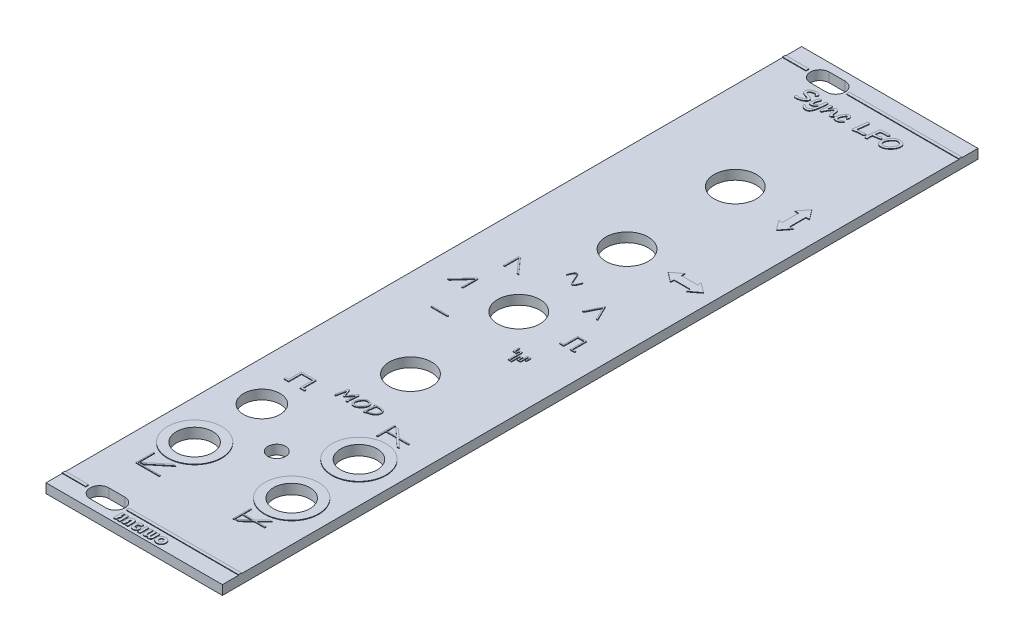
from build123d import *

# Parameters (mm, degrees)
SKIZZE2_W                       = 30
SKIZZE2_H                       = 128.5
AUFSATZ_LINEAR_AUSTRAGEN1_DEPTH = 0.8
SKIZZE3_W                       = 4
SKIZZE3_H                       = 0.5
SKIZZE3_W_2                     = 19.1
SKIZZE3_W_3                     = 0.4375
SKIZZE3_H_2                     = 1.5
AUFSATZ_LINEAR_AUSTRAGEN2_DEPTH = 0.1
SKIZZE4_R                       = 3.6
SKIZZE4_R_2                     = 3.1
SKIZZE4_R_3                     = 1.5
SCHNITT_LINEAR_AUSTRAGEN1_DEPTH = 66.99714021
AUFSATZ_LINEAR_START            = 0.1
SKIZZE5_R                       = 4.6
SKIZZE5_R_2                     = 3.1
SKIZZE5_W                       = 2.8
SKIZZE5_H                       = 0.2
AUFSATZ_LINEAR_AUSTRAGEN3_DEPTH = 0.1


with BuildPart() as part:
    # Skizze2 → Aufsatz-Linear austragen1 (new, symmetric)
    with BuildSketch(Plane(origin=(0, 0, 0), x_dir=(1, 0, 0), z_dir=(0, 1, 0))):
        Rectangle(SKIZZE2_W, SKIZZE2_H)
        with BuildLine():
            Line((-8.9, 62.85), (-6.2, 62.85))
            ThreePointArc((-6.2, 62.85), (-4.6, 61.25), (-6.2, 59.65))
            Line((-6.2, 59.65), (-8.9, 59.65))
            ThreePointArc((-8.9, 59.65), (-10.5, 61.25), (-8.9, 62.85))
        make_face(mode=Mode.SUBTRACT)
        with BuildLine():
            Line((-8.9, -59.65), (-6.2, -59.65))
            ThreePointArc((-6.2, -59.65), (-4.6, -61.25), (-6.2, -62.85))
            Line((-6.2, -62.85), (-8.9, -62.85))
            ThreePointArc((-8.9, -62.85), (-10.5, -61.25), (-8.9, -59.65))
        make_face(mode=Mode.SUBTRACT)
    extrude(amount=AUFSATZ_LINEAR_AUSTRAGEN1_DEPTH, both=True)

    # Skizze3 → Aufsatz-Linear austragen2 (add)
    # profile 1 of 18: a face of its own
    with BuildSketch(Plane(origin=(0, 0.8, 0), x_dir=(1, 0, 0), z_dir=(0, 1, 0))):
        with Locations((-13, 61.25)):
            Rectangle(SKIZZE3_W, SKIZZE3_H)
    # profile 2 of 18: a face of its own
    with BuildSketch(Plane(origin=(0, 0.8, 0), x_dir=(1, 0, 0), z_dir=(0, 1, 0))):
        with Locations((5.45, 61.25)):
            Rectangle(SKIZZE3_W_2, SKIZZE3_H)
    # profile 3 of 18: a face of its own
    with BuildSketch(Plane(origin=(0, 0.8, 0), x_dir=(1, 0, 0), z_dir=(0, 1, 0))):
        with Locations((-13, -61.25)):
            Rectangle(SKIZZE3_W, SKIZZE3_H)
    # profile 4 of 18: a face of its own
    with BuildSketch(Plane(origin=(0, 0.8, 0), x_dir=(1, 0, 0), z_dir=(0, 1, 0))):
        with Locations((5.45, -61.25)):
            Rectangle(SKIZZE3_W_2, SKIZZE3_H)
    # profile 5 of 18: a face of its own
    with BuildSketch(Plane(origin=(0, 0.8, 0), x_dir=(1, 0, 0), z_dir=(0, 1, 0))):
        with BuildLine():
            add(Edge.make_bspline(
                [(-6.554487179, 58.076923077), (-6.554792276, 58.089954635), (-6.555380523, 58.115080409), (-6.559371742, 58.151100402), (-6.565808299, 58.184181785), (-6.575068487, 58.214240665), (-6.587831737, 58.241030518), (-6.602709521, 58.264812984), (-6.62073276, 58.285307499), (-6.648611047, 58.309037053), (-6.691446947, 58.332197608), (-6.750817444, 58.352285228), (-6.820517996, 58.363278599), (-6.87012241, 58.364652876), (-6.896534455, 58.365384615)],
                knots=[0, 0, 0, 0, 0.906402374, 1.747608368, 2.517333154, 3.24814885, 3.928613535, 4.576077804, 5.193261821, 5.819231433, 7.114055839, 8.549859266, 10.162960399, 12, 12, 12, 12], degree=3))
            add(Edge.make_bspline(
                [(-6.896534455, 58.365384615), (-6.920253958, 58.365038264), (-6.967450178, 58.364349106), (-7.037550688, 58.357630565), (-7.106485966, 58.34665715), (-7.174002732, 58.33099661), (-7.240347223, 58.311595223), (-7.305218052, 58.287355602), (-7.368717945, 58.258785319), (-7.429928384, 58.22668327), (-7.486993351, 58.192396182), (-7.537071679, 58.155980418), (-7.579533328, 58.118795538), (-7.61484161, 58.081092478), (-7.642179408, 58.042015312), (-7.661620784, 58.001795206), (-7.673855124, 57.960612897), (-7.675475711, 57.93260534), (-7.676282051, 57.918669872)],
                knots=[0, 0, 0, 0, 1.173513515, 2.335015257, 3.481258319, 4.625505193, 5.762542775, 6.899580358, 8.049538388, 9.20609429, 10.318252372, 11.341037553, 12.265816017, 13.107698889, 13.891396945, 14.615581821, 15.3111675, 16, 16, 16, 16], degree=3))
            add(Edge.make_bspline(
                [(-7.676282051, 57.918669872), (-7.675351809, 57.901470904), (-7.673503557, 57.867299146), (-7.65454089, 57.818847934), (-7.625895656, 57.77399851), (-7.591703805, 57.740649349), (-7.555753348, 57.71543561), (-7.519152003, 57.694929109), (-7.473609523, 57.673839009), (-7.419089516, 57.651266311), (-7.355759185, 57.627476218), (-7.283323502, 57.602314509), (-7.201843133, 57.57662452), (-7.144448048, 57.559204951), (-7.114383013, 57.550080128)],
                knots=[0, 0, 0, 0, 0.857806506, 1.704332341, 2.569442913, 3.509531975, 4.073290341, 4.766075466, 5.607631439, 6.585913625, 7.721123853, 8.995679988, 10.426259167, 12, 12, 12, 12], degree=3))
            add(Edge.make_bspline(
                [(-7.114383013, 57.550080128), (-7.082288039, 57.540372952), (-7.019875563, 57.521496199), (-6.929720693, 57.491666192), (-6.846138125, 57.460515717), (-6.768769217, 57.429228975), (-6.698203121, 57.396573653), (-6.633766535, 57.363786405), (-6.576114617, 57.329509271), (-6.52422241, 57.295254829), (-6.478561368, 57.259357675), (-6.438830671, 57.222078783), (-6.405422995, 57.18246917), (-6.377419958, 57.141472519), (-6.356356994, 57.097998276), (-6.341202718, 57.053088665), (-6.331784624, 57.006434282), (-6.330685059, 56.974703349), (-6.330128205, 56.958633814)],
                knots=[0, 0, 0, 0, 1.533278363, 2.981641283, 4.341462187, 5.611592881, 6.796784914, 7.8961211, 8.915963566, 9.862338178, 10.737403261, 11.568934021, 12.348901324, 13.10261463, 13.8332049, 14.55014861, 15.265749993, 16, 16, 16, 16], degree=3))
            add(Edge.make_bspline(
                [(-6.330128205, 56.958633814), (-6.330551713, 56.945094435), (-6.331396921, 56.918073442), (-6.33707231, 56.87764472), (-6.346476184, 56.837689946), (-6.360278053, 56.798179912), (-6.377926126, 56.759269099), (-6.39879434, 56.720508316), (-6.424358557, 56.682906932), (-6.452950635, 56.645161105), (-6.48533763, 56.60761974), (-6.522383706, 56.571076369), (-6.562638949, 56.534583666), (-6.607188535, 56.49896429), (-6.655109215, 56.463515053), (-6.706851974, 56.428355611), (-6.762512918, 56.393817206), (-6.841564328, 56.348894017), (-6.943288528, 56.296108935), (-7.068098583, 56.241014963), (-7.194008843, 56.194265848), (-7.321108755, 56.156035471), (-7.449583776, 56.126321382), (-7.579447307, 56.105636483), (-7.71036928, 56.091765731), (-7.798108419, 56.090418346), (-7.842047276, 56.08974359)],
                knots=[0, 0, 0, 0, 0.5187735, 1.035333725, 1.561313845, 2.089312793, 2.636193803, 3.197256931, 3.773858138, 4.376450433, 5.011316299, 5.671708173, 6.369225161, 7.092518106, 7.856315086, 8.652943441, 9.488995308, 10.365732564, 12.136680431, 13.87798964, 15.590258505, 17.28009585, 18.960608946, 20.639026699, 22.316859238, 24, 24, 24, 24], degree=3))
            add(Edge.make_bspline(
                [(-7.842047276, 56.08974359), (-7.869314378, 56.090534311), (-7.921381125, 56.092044198), (-7.995427587, 56.105422601), (-8.060879167, 56.128518067), (-8.117251757, 56.159886172), (-8.163163641, 56.197874866), (-8.196352003, 56.241566786), (-8.217632519, 56.289761469), (-8.219972493, 56.323907136), (-8.221153846, 56.341145833)],
                knots=[0, 0, 0, 0, 1.297603202, 2.477783481, 3.566400177, 4.587824728, 5.535348993, 6.381086706, 7.182679451, 8, 8, 8, 8], degree=3))
            add(Edge.make_bspline(
                [(-8.221153846, 56.341145833), (-8.22055929, 56.35504601), (-8.219387383, 56.382444113), (-8.210503534, 56.422804056), (-8.195871254, 56.46161342), (-8.175848899, 56.49775702), (-8.151983821, 56.529201796), (-8.124791637, 56.553212789), (-8.094084742, 56.567871064), (-8.072558103, 56.56963794), (-8.061899038, 56.570512821)],
                knots=[0, 0, 0, 0, 1.09104836, 2.150523334, 3.229292305, 4.338466151, 5.384880842, 6.314926839, 7.165624346, 8, 8, 8, 8], degree=3))
            add(Edge.make_bspline(
                [(-8.061899038, 56.570512821), (-8.048906404, 56.570037273), (-8.023583523, 56.569110423), (-7.999841664, 56.560286257), (-7.98828125, 56.555989583)],
                knots=[0, 0, 0, 0, 1.02615765, 2, 2, 2, 2], degree=3))
            add(Edge.make_bspline(
                [(-7.98828125, 56.555989583), (-7.95962107, 56.543548671), (-7.904199429, 56.519491049), (-7.820072997, 56.49412276), (-7.739051745, 56.477322432), (-7.685706741, 56.475328821), (-7.659755609, 56.474358974)],
                knots=[0, 0, 0, 0, 1.098568057, 2.124356644, 3.08754215, 4, 4, 4, 4], degree=3))
            add(Edge.make_bspline(
                [(-7.659755609, 56.474358974), (-7.637534417, 56.474880971), (-7.592486852, 56.475939181), (-7.523945288, 56.483453811), (-7.453446397, 56.49463709), (-7.381131631, 56.511882823), (-7.306405401, 56.531740344), (-7.230312131, 56.558680647), (-7.151624815, 56.588196499), (-7.073239047, 56.622829938), (-6.99868368, 56.659034113), (-6.932086878, 56.695995067), (-6.875832119, 56.732797801), (-6.829566696, 56.769346833), (-6.793196661, 56.805912032), (-6.767219214, 56.842693336), (-6.749817903, 56.87956255), (-6.747776886, 56.904884106), (-6.746794872, 56.917067308)],
                knots=[0, 0, 0, 0, 0.998407811, 2.024006686, 3.095701557, 4.203923579, 5.363194645, 6.568305019, 7.829119502, 9.13920479, 10.417417365, 11.552604318, 12.559598689, 13.434741063, 14.198645492, 14.866660536, 15.454705579, 16, 16, 16, 16], degree=3))
            add(Edge.make_bspline(
                [(-6.746794872, 56.917067308), (-6.747796313, 56.927112164), (-6.749898321, 56.948196146), (-6.767483464, 56.977955741), (-6.79376575, 57.00683731), (-6.823610453, 57.029163182), (-6.853176013, 57.048016261), (-6.882037334, 57.062773876), (-6.915996089, 57.078676261), (-6.955231932, 57.095735488), (-6.999612758, 57.113701763), (-7.049464321, 57.132154252), (-7.104549601, 57.151712767), (-7.143241342, 57.164691637), (-7.163461538, 57.171474359)],
                knots=[0, 0, 0, 0, 0.705055393, 1.479899142, 2.381053134, 3.45574198, 4.096430202, 4.855344606, 5.740803536, 6.743317339, 7.874456067, 9.119680589, 10.494753019, 12, 12, 12, 12], degree=3))
            add(Edge.make_bspline(
                [(-7.163461538, 57.171474359), (-7.193211082, 57.181219424), (-7.250804879, 57.200085438), (-7.33380982, 57.229161677), (-7.411696047, 57.25498575), (-7.483201915, 57.281774152), (-7.549824184, 57.305191989), (-7.610432698, 57.328497473), (-7.665393749, 57.349932122), (-7.730122956, 57.375835326), (-7.802140365, 57.410680354), (-7.87896405, 57.45877243), (-7.944033836, 57.513742815), (-7.998674706, 57.57429173), (-8.04176987, 57.641736607), (-8.070971385, 57.716501906), (-8.089840342, 57.797213028), (-8.091893428, 57.853288492), (-8.092948718, 57.882111378)],
                knots=[0, 0, 0, 0, 1.187231806, 2.298428188, 3.335533646, 4.298883082, 5.194081272, 6.01363673, 6.761378685, 7.431520568, 8.657552091, 9.790397189, 10.859624885, 11.877517786, 12.87343661, 13.876274057, 14.908401178, 16, 16, 16, 16], degree=3))
            add(Edge.make_bspline(
                [(-8.092948718, 57.882111378), (-8.091706528, 57.908571416), (-8.089220343, 57.961529929), (-8.071621792, 58.040119181), (-8.041926783, 58.116903551), (-8.001113145, 58.192354702), (-7.948107094, 58.265879465), (-7.883977785, 58.338105379), (-7.808633067, 58.409219925), (-7.722759626, 58.477402775), (-7.62920272, 58.540731165), (-7.530494265, 58.597193538), (-7.427185276, 58.644428584), (-7.319916394, 58.682917172), (-7.20872378, 58.713076961), (-7.09354691, 58.734713599), (-6.974268359, 58.747197413), (-6.893391267, 58.749058307), (-6.852463942, 58.75)],
                knots=[0, 0, 0, 0, 0.767401818, 1.535918413, 2.323829708, 3.149434188, 4.017565943, 4.947439468, 5.94777927, 7.019533282, 8.12502747, 9.222515199, 10.314732901, 11.416188546, 12.525241406, 13.65367676, 14.812658419, 16, 16, 16, 16], degree=3))
            add(Edge.make_bspline(
                [(-6.852463942, 58.75), (-6.829253491, 58.74953772), (-6.783947448, 58.748635365), (-6.717673643, 58.743872061), (-6.655125288, 58.734816167), (-6.59634991, 58.722425163), (-6.541580897, 58.70641134), (-6.490492409, 58.68696126), (-6.443462644, 58.66318774), (-6.399950352, 58.636914991), (-6.361142699, 58.608102987), (-6.327534953, 58.577863717), (-6.298317945, 58.547407423), (-6.27523854, 58.515030055), (-6.256884303, 58.481794897), (-6.243817356, 58.447419953), (-6.235264799, 58.412042562), (-6.234405238, 58.387968999), (-6.233974359, 58.375901442)],
                knots=[0, 0, 0, 0, 1.40143273, 2.735550995, 4.008304895, 5.214057515, 6.35892893, 7.450064129, 8.509221683, 9.535900356, 10.515497815, 11.421908727, 12.263292432, 13.057608652, 13.815276371, 14.548971511, 15.272630835, 16, 16, 16, 16], degree=3))
            add(Edge.make_bspline(
                [(-6.233974359, 58.375901442), (-6.234798492, 58.352436583), (-6.236354612, 58.308130447), (-6.251528685, 58.246124886), (-6.276570363, 58.193095123), (-6.31267294, 58.149565966), (-6.359417774, 58.116391679), (-6.415806337, 58.092882133), (-6.48204021, 58.078973213), (-6.529375142, 58.077633708), (-6.554487179, 58.076923077)],
                knots=[0, 0, 0, 0, 1.119776942, 2.114352742, 3.027799396, 3.900150592, 4.785861252, 5.740201081, 6.801135797, 8, 8, 8, 8], degree=3))
        make_face()
    # profile 6 of 18: a face of its own
    with BuildSketch(Plane(origin=(0, 0.8, 0), x_dir=(1, 0, 0), z_dir=(0, 1, 0))):
        with BuildLine():
            add(Edge.make_bspline(
                [(-4.278846154, 57.242588141), (-4.283996789, 57.174281292), (-4.294234775, 57.03850686), (-4.315815395, 56.836747289), (-4.342986953, 56.638034002), (-4.374956661, 56.443293871), (-4.413480591, 56.254245877), (-4.460199814, 56.073346796), (-4.516062929, 55.901552372), (-4.568958419, 55.765470099), (-4.614550368, 55.663263791), (-4.649855016, 55.593885966), (-4.684290022, 55.529977529), (-4.720860749, 55.473055334), (-4.757359813, 55.422008808), (-4.795241146, 55.377631206), (-4.833279145, 55.339281564), (-4.87229817, 55.306661466), (-4.912770664, 55.279488364), (-4.954924172, 55.256254304), (-4.998678675, 55.236174241), (-5.044528527, 55.220243261), (-5.092044787, 55.207563364), (-5.141435453, 55.198553353), (-5.192878004, 55.19368032), (-5.227688224, 55.19277045), (-5.245392628, 55.192307692)],
                knots=[0, 0, 0, 0, 2.00175863, 3.978922287, 5.928656077, 7.862296602, 9.745190496, 11.565024947, 13.319121211, 15.02136192, 15.829252738, 16.588486283, 17.295924739, 17.949578658, 18.564337243, 19.128401805, 19.652735712, 20.141187321, 20.61204981, 21.074986084, 21.546555649, 22.017140067, 22.491652805, 22.982534536, 23.48251923, 24, 24, 24, 24], degree=3))
            add(Edge.make_bspline(
                [(-5.245392628, 55.192307692), (-5.283681756, 55.193370705), (-5.359595355, 55.195478276), (-5.47225844, 55.212299364), (-5.582764606, 55.238577155), (-5.653627192, 55.265478772), (-5.689102564, 55.278946314)],
                knots=[0, 0, 0, 0, 1.009780963, 2.002033224, 2.999773803, 4, 4, 4, 4], degree=3))
            Line((-5.689102564, 55.278946314), (-5.693609776, 55.278946314))
            add(Edge.make_bspline(
                [(-5.693609776, 55.278946314), (-5.722746209, 55.291950624), (-5.780242179, 55.317612495), (-5.861290164, 55.364766522), (-5.936705998, 55.417843696), (-5.994233932, 55.467312137), (-6.035434877, 55.508722169), (-6.062677961, 55.538019835), (-6.085375245, 55.56646446), (-6.104659369, 55.593214715), (-6.119392928, 55.619236626), (-6.12938621, 55.64423366), (-6.136642092, 55.667662226), (-6.137440835, 55.683212997), (-6.137820513, 55.690604968)],
                knots=[0, 0, 0, 0, 1.828278267, 3.607807206, 5.365739559, 7.109782234, 7.94897562, 8.714472704, 9.402051214, 10.034024339, 10.603878186, 11.110416056, 11.577141299, 12, 12, 12, 12], degree=3))
            add(Edge.make_bspline(
                [(-6.137820513, 55.690604968), (-6.137425667, 55.703345765), (-6.136674887, 55.7275718), (-6.128689821, 55.7617634), (-6.117214867, 55.7925), (-6.099083569, 55.818113436), (-6.077954092, 55.839565848), (-6.052439007, 55.8542858), (-6.024309607, 55.863854643), (-6.00435468, 55.864864949), (-5.994090545, 55.865384615)],
                knots=[0, 0, 0, 0, 1.20059287, 2.282871583, 3.301520604, 4.276547981, 5.224045995, 6.121579836, 7.033804691, 8, 8, 8, 8], degree=3))
            add(Edge.make_bspline(
                [(-5.994090545, 55.865384615), (-5.9851726, 55.864787687), (-5.967583044, 55.863610319), (-5.942416923, 55.854754594), (-5.91961012, 55.839859453), (-5.907640232, 55.825991056), (-5.901442308, 55.818810096)],
                knots=[0, 0, 0, 0, 0.994717393, 1.961958436, 2.944716275, 4, 4, 4, 4], degree=3))
            add(Edge.make_bspline(
                [(-5.901442308, 55.818810096), (-5.882432127, 55.796935156), (-5.84476622, 55.753593145), (-5.779254056, 55.697707846), (-5.70773387, 55.650386255), (-5.629887233, 55.611500225), (-5.545764061, 55.581570992), (-5.455478154, 55.559937426), (-5.358916323, 55.547575647), (-5.292503039, 55.545788915), (-5.258413462, 55.544871795)],
                knots=[0, 0, 0, 0, 0.959799894, 1.901703793, 2.844225409, 3.797170874, 4.779307156, 5.798199044, 6.869827527, 8, 8, 8, 8], degree=3))
            add(Edge.make_bspline(
                [(-5.258413462, 55.544871795), (-5.244065818, 55.545968824), (-5.214610395, 55.548221003), (-5.171490498, 55.566438996), (-5.1290802, 55.594560803), (-5.087432117, 55.63402925), (-5.046461781, 55.684207817), (-5.006039691, 55.745263476), (-4.966240962, 55.817335886), (-4.926862188, 55.898944639), (-4.888988382, 55.988211663), (-4.855331227, 56.083371362), (-4.824639683, 56.182753784), (-4.797719332, 56.286551093), (-4.774106427, 56.394604264), (-4.754780606, 56.507267192), (-4.738503695, 56.624154172), (-4.731246007, 56.70385683), (-4.727564103, 56.744290865)],
                knots=[0, 0, 0, 0, 0.497393467, 1.021138791, 1.603813841, 2.260843158, 3.006854359, 3.851866658, 4.802775032, 5.866932167, 7.000819296, 8.171935065, 9.374281906, 10.615766538, 11.898609708, 13.218103299, 14.588713216, 16, 16, 16, 16], degree=3))
            add(Edge.make_bspline(
                [(-4.727564103, 56.744290865), (-4.749173627, 56.726812697), (-4.791526238, 56.69255715), (-4.855293938, 56.644219908), (-4.916690248, 56.598521458), (-4.976307208, 56.556447492), (-5.033877492, 56.517810874), (-5.089686068, 56.482626098), (-5.143441915, 56.450691323), (-5.195392096, 56.421998616), (-5.245189941, 56.39608674), (-5.293849797, 56.375025005), (-5.340017774, 56.355915867), (-5.384500116, 56.341246055), (-5.426797035, 56.328751862), (-5.46748302, 56.32026491), (-5.506334709, 56.314966481), (-5.531668809, 56.314383391), (-5.543870192, 56.314102564)],
                knots=[0, 0, 0, 0, 1.423599046, 2.79011861, 4.09846614, 5.344025416, 6.527481519, 7.64963328, 8.723129498, 9.729766038, 10.689663664, 11.5969681, 12.444908703, 13.248030334, 13.995066441, 14.702796591, 15.375242186, 16, 16, 16, 16], degree=3))
            add(Edge.make_bspline(
                [(-5.543870192, 56.314102564), (-5.558924258, 56.314591162), (-5.588365426, 56.31554671), (-5.631360073, 56.32282628), (-5.671950568, 56.334128154), (-5.710188249, 56.350423177), (-5.745823196, 56.371556503), (-5.779072887, 56.39750411), (-5.810329447, 56.427434444), (-5.838037949, 56.462379081), (-5.863606011, 56.499835869), (-5.884687229, 56.540413509), (-5.904374989, 56.581789507), (-5.918951548, 56.625820424), (-5.931481082, 56.671344714), (-5.938748822, 56.71909907), (-5.945030922, 56.768333422), (-5.945350368, 56.801860352), (-5.945512821, 56.818910256)],
                knots=[0, 0, 0, 0, 1.00165068, 1.958923706, 2.894604517, 3.800718374, 4.717400304, 5.644263435, 6.603018757, 7.590515506, 8.607580867, 9.61684597, 10.631236758, 11.653871804, 12.699670095, 13.770207859, 14.866053566, 16, 16, 16, 16], degree=3))
            add(Edge.make_bspline(
                [(-5.945512821, 56.818910256), (-5.945190536, 56.83728067), (-5.944509971, 56.876073315), (-5.939673723, 56.93704762), (-5.932132452, 57.003854614), (-5.92129828, 57.076424284), (-5.908599156, 57.155185672), (-5.891551786, 57.239678025), (-5.87294142, 57.330329286), (-5.850632636, 57.424027662), (-5.827670123, 57.51594507), (-5.805961977, 57.601266005), (-5.784448227, 57.677091035), (-5.763506985, 57.743316646), (-5.743971726, 57.800319196), (-5.725863503, 57.848045309), (-5.707983874, 57.886233416), (-5.690593827, 57.916417607), (-5.671635738, 57.939977481), (-5.651112302, 57.959789123), (-5.627431152, 57.975988849), (-5.601516993, 57.989394924), (-5.572972332, 58.000133215), (-5.541836465, 58.007440544), (-5.508116262, 58.012037069), (-5.48479135, 58.012553863), (-5.47275641, 58.012820513)],
                knots=[0, 0, 0, 0, 0.957882983, 2.022753196, 3.187830127, 4.463193325, 5.848458912, 7.347352035, 8.957267661, 10.67387793, 12.369190335, 13.897767392, 15.264447206, 16.478539246, 17.51911675, 18.406578563, 19.138609515, 19.716347969, 20.217988658, 20.71055982, 21.198338869, 21.708368279, 22.228984612, 22.784251995, 23.372711278, 24, 24, 24, 24], degree=3))
            add(Edge.make_bspline(
                [(-5.47275641, 58.012820513), (-5.459958273, 58.011973039), (-5.435141801, 58.010329729), (-5.400048524, 57.996879357), (-5.370727534, 57.973133244), (-5.347475303, 57.9416946), (-5.328041683, 57.906301603), (-5.314755934, 57.867618094), (-5.305579096, 57.82728725), (-5.30485459, 57.799531952), (-5.304487179, 57.785456731)],
                knots=[0, 0, 0, 0, 0.975068157, 1.890724535, 2.815992283, 3.81498953, 4.858259611, 5.885852315, 6.927876886, 8, 8, 8, 8], degree=3))
            add(Edge.make_bspline(
                [(-5.304487179, 57.785456731), (-5.30511173, 57.782108232), (-5.306850906, 57.772783721), (-5.31216191, 57.755177163), (-5.321359929, 57.730415663), (-5.333991493, 57.697997713), (-5.350602581, 57.658437401), (-5.369989582, 57.610993583), (-5.393741084, 57.556565626), (-5.410660536, 57.517696211), (-5.419671474, 57.496995192)],
                knots=[0, 0, 0, 0, 0.262791583, 0.731791455, 1.416486415, 2.301768724, 3.41677343, 4.728012174, 6.257409342, 8, 8, 8, 8], degree=3))
            add(Edge.make_bspline(
                [(-5.419671474, 57.496995192), (-5.430913204, 57.470709243), (-5.452812701, 57.419502796), (-5.481093632, 57.343164263), (-5.506223604, 57.270103594), (-5.525473671, 57.199223639), (-5.541350285, 57.131301408), (-5.552126229, 57.066042677), (-5.559932354, 57.003727708), (-5.560580813, 56.962996715), (-5.560897436, 56.943108974)],
                knots=[0, 0, 0, 0, 1.192149486, 2.322371505, 3.394578435, 4.41311333, 5.384264131, 6.302223776, 7.171026013, 8, 8, 8, 8], degree=3))
            add(Edge.make_bspline(
                [(-5.560897436, 56.943108974), (-5.560637446, 56.924384067), (-5.560148119, 56.889141868), (-5.553351564, 56.839896864), (-5.544013322, 56.797240184), (-5.529705017, 56.762091691), (-5.51245678, 56.73505235), (-5.495801679, 56.714714051), (-5.477575377, 56.701517242), (-5.464401652, 56.69961068), (-5.458233173, 56.698717949)],
                knots=[0, 0, 0, 0, 1.580255723, 2.974203494, 4.191749841, 5.260131258, 6.159911468, 6.889464284, 7.480001601, 8, 8, 8, 8], degree=3))
            add(Edge.make_bspline(
                [(-5.458233173, 56.698717949), (-5.443840742, 56.699375731), (-5.413306067, 56.700771268), (-5.365431183, 56.710392253), (-5.313588611, 56.726360543), (-5.256642449, 56.747360457), (-5.195216515, 56.776965871), (-5.128957177, 56.815201095), (-5.057332708, 56.862111009), (-4.996521944, 56.907638093), (-4.946762448, 56.94499562), (-4.912858924, 56.972984893), (-4.881562808, 56.998018728), (-4.854693767, 57.022484706), (-4.830512258, 57.0440325), (-4.810545809, 57.064480974), (-4.793136399, 57.082078395), (-4.775608695, 57.104805468), (-4.756492133, 57.133775321), (-4.737022188, 57.172130227), (-4.720145669, 57.21492404), (-4.707678157, 57.254535459), (-4.699357985, 57.29186701), (-4.692817918, 57.327586894), (-4.686955309, 57.370875094), (-4.681590399, 57.421486837), (-4.676706609, 57.479611836), (-4.671602944, 57.545034476), (-4.667177524, 57.617997606), (-4.664737154, 57.66910089), (-4.663461538, 57.695813301)],
                knots=[0, 0, 0, 0, 0.851049212, 1.805567829, 2.876887701, 4.057728334, 5.391278813, 6.903488802, 8.579188005, 10.45103088, 11.394819902, 12.258204215, 13.050729787, 13.763972059, 14.406785208, 14.965225586, 15.454060319, 15.868798653, 16.660093594, 17.503377858, 18.407130841, 19.378249266, 19.955398139, 20.667956902, 21.52516743, 22.537942204, 23.677497575, 24.974482115, 26.418518934, 28, 28, 28, 28], degree=3))
            add(Edge.make_bspline(
                [(-4.663461538, 57.695813301), (-4.66288018, 57.711342664), (-4.661773281, 57.740910397), (-4.658859833, 57.782937981), (-4.657265376, 57.820542574), (-4.654612388, 57.85358162), (-4.652113245, 57.881956024), (-4.649893488, 57.905900126), (-4.646568282, 57.925170587), (-4.643768766, 57.945434179), (-4.636412293, 57.967259206), (-4.623944432, 57.991712335), (-4.605764025, 58.014269002), (-4.584004942, 58.035808195), (-4.557545164, 58.054771336), (-4.525767779, 58.067468258), (-4.490117511, 58.075856431), (-4.464864228, 58.076556168), (-4.451622596, 58.076923077)],
                knots=[0, 0, 0, 0, 1.488084273, 2.833295677, 4.033959135, 5.092066823, 6.006775041, 6.76236265, 7.393156644, 7.879355698, 8.718589273, 9.583762216, 10.495111641, 11.478615764, 12.511918219, 13.586680609, 14.73456909, 16, 16, 16, 16], degree=3))
            add(Edge.make_bspline(
                [(-4.451622596, 58.076923077), (-4.434384482, 58.076431777), (-4.40213916, 58.07551276), (-4.357876799, 58.066773135), (-4.321170767, 58.052332146), (-4.296448054, 58.034168194), (-4.281368253, 58.014938051), (-4.271982128, 57.99653799), (-4.264174425, 57.97444151), (-4.257572518, 57.948304666), (-4.252844203, 57.918121342), (-4.249558346, 57.883831969), (-4.246746331, 57.845764187), (-4.246778172, 57.819016555), (-4.246794872, 57.804987981)],
                knots=[0, 0, 0, 0, 1.539771471, 2.880270119, 4.011047751, 5.043823079, 5.575249402, 6.182747175, 6.881468037, 7.666926675, 8.589438527, 9.609629148, 10.746300379, 12, 12, 12, 12], degree=3))
            Line((-4.246794872, 57.804987981), (-4.278846154, 57.242588141))
        make_face()
    # profile 7 of 18: a face of its own
    with BuildSketch(Plane(origin=(0, 0.8, 0), x_dir=(1, 0, 0), z_dir=(0, 1, 0))):
        with BuildLine():
            add(Edge.make_bspline(
                [(-2.498497596, 56.491386218), (-2.505094283, 56.505974986), (-2.519242704, 56.537264636), (-2.536433191, 56.590008415), (-2.552119662, 56.651147857), (-2.56715225, 56.72078812), (-2.580515258, 56.799000114), (-2.592296896, 56.88589289), (-2.603424669, 56.981208351), (-2.609186303, 57.047758666), (-2.612179487, 57.082331731)],
                knots=[0, 0, 0, 0, 0.635309353, 1.362596704, 2.198551025, 3.141039548, 4.190361142, 5.347965813, 6.622261201, 8, 8, 8, 8], degree=3))
            add(Edge.make_bspline(
                [(-2.612179487, 57.082331731), (-2.615358876, 57.117422506), (-2.621324969, 57.18327002), (-2.634480254, 57.274792226), (-2.650926413, 57.35243371), (-2.669125382, 57.416289478), (-2.690723413, 57.466631896), (-2.715471651, 57.502847535), (-2.74418972, 57.527578612), (-2.766396963, 57.530611143), (-2.776943109, 57.532051282)],
                knots=[0, 0, 0, 0, 1.669474181, 3.132752831, 4.378613114, 5.427244083, 6.277016499, 6.957496843, 7.504918713, 8, 8, 8, 8], degree=3))
            add(Edge.make_bspline(
                [(-2.776943109, 57.532051282), (-2.782326407, 57.531596972), (-2.793674934, 57.530639242), (-2.811005551, 57.524534281), (-2.829583475, 57.515371135), (-2.849769602, 57.502678496), (-2.871067587, 57.486079108), (-2.893789701, 57.465807164), (-2.91763419, 57.441684096), (-2.943147881, 57.414091843), (-2.970194671, 57.383156518), (-2.998274857, 57.348169565), (-3.028229469, 57.309948808), (-3.059248365, 57.267834137), (-3.09131951, 57.221865579), (-3.125355721, 57.17266131), (-3.160301413, 57.119383111), (-3.208180908, 57.045289366), (-3.26580957, 56.953792531), (-3.329296972, 56.84809817), (-3.386109565, 56.750382331), (-3.435895268, 56.660400936), (-3.478090031, 56.577683538), (-3.513118245, 56.502673753), (-3.541853985, 56.435568521), (-3.556426084, 56.392650353), (-3.563201122, 56.372696314)],
                knots=[0, 0, 0, 0, 0.271980462, 0.573361889, 0.920377903, 1.318197382, 1.775334971, 2.283114329, 2.855616678, 3.488204608, 4.181621449, 4.931087743, 5.754362313, 6.6348723, 7.573144249, 8.586073116, 9.657392542, 10.791975691, 13.043014552, 15.120014281, 17.020774108, 18.75331067, 20.314831487, 21.710866525, 22.935708098, 24, 24, 24, 24], degree=3))
            add(Edge.make_bspline(
                [(-3.563201122, 56.372696314), (-3.565904689, 56.361915576), (-3.57117663, 56.3408932), (-3.584043661, 56.311466017), (-3.600041913, 56.284852619), (-3.618785234, 56.261638916), (-3.638968947, 56.242573839), (-3.659827307, 56.228866875), (-3.680443217, 56.219347997), (-3.694657125, 56.218399946), (-3.701422276, 56.217948718)],
                knots=[0, 0, 0, 0, 1.20417918, 2.348142232, 3.469513409, 4.564237853, 5.576761071, 6.465938645, 7.269859125, 8, 8, 8, 8], degree=3))
            add(Edge.make_bspline(
                [(-3.701422276, 56.217948718), (-3.721504068, 56.218713001), (-3.759335826, 56.220152822), (-3.812570693, 56.230886627), (-3.85780671, 56.249860055), (-3.895518214, 56.276467459), (-3.924220946, 56.311717411), (-3.944259583, 56.354356491), (-3.956464833, 56.404248644), (-3.957685018, 56.439894544), (-3.958333333, 56.458834135)],
                knots=[0, 0, 0, 0, 1.194318992, 2.249957814, 3.210972496, 4.092954214, 4.967750625, 5.88271545, 6.875031845, 8, 8, 8, 8], degree=3))
            add(Edge.make_bspline(
                [(-3.958333333, 56.458834135), (-3.958059314, 56.46668324), (-3.957434588, 56.48457812), (-3.954793759, 56.514825906), (-3.950139164, 56.551524964), (-3.944062979, 56.594754752), (-3.936624481, 56.644376593), (-3.927034448, 56.700462237), (-3.915382158, 56.763009527), (-3.907094623, 56.806892934), (-3.902744391, 56.829927885)],
                knots=[0, 0, 0, 0, 0.501863737, 1.144180291, 1.939451587, 2.865813695, 3.934029402, 5.145949852, 6.50187323, 8, 8, 8, 8], degree=3))
            add(Edge.make_bspline(
                [(-3.902744391, 56.829927885), (-3.896833603, 56.861940422), (-3.884706653, 56.927619386), (-3.8706378, 57.029259804), (-3.8580935, 57.135950625), (-3.847506693, 57.247809404), (-3.83956169, 57.364872515), (-3.834285359, 57.487275456), (-3.830530639, 57.614827017), (-3.830264043, 57.701653084), (-3.830128205, 57.745893429)],
                knots=[0, 0, 0, 0, 0.848972436, 1.741806054, 2.6755722, 3.650807885, 4.672020689, 5.735473538, 6.846159507, 8, 8, 8, 8], degree=3))
            add(Edge.make_bspline(
                [(-3.830128205, 57.745893429), (-3.829103308, 57.759656787), (-3.826965704, 57.788362691), (-3.813832307, 57.831878307), (-3.791513697, 57.876207263), (-3.762598573, 57.920064829), (-3.729064848, 57.959506132), (-3.693175379, 57.990257509), (-3.654610982, 58.00887677), (-3.628142866, 58.011531046), (-3.615284455, 58.012820513)],
                knots=[0, 0, 0, 0, 0.894812457, 1.866288767, 2.928706177, 4.111051818, 5.272311139, 6.282034119, 7.165399174, 8, 8, 8, 8], degree=3))
            add(Edge.make_bspline(
                [(-3.615284455, 58.012820513), (-3.599869589, 58.012372088), (-3.570706842, 58.011523731), (-3.529773457, 58.001791814), (-3.494441187, 57.986161704), (-3.46865771, 57.967714391), (-3.452382583, 57.947027589), (-3.44124334, 57.926911238), (-3.433315221, 57.901081626), (-3.425555038, 57.870746147), (-3.420690967, 57.834943088), (-3.415665756, 57.794434388), (-3.414326055, 57.748568339), (-3.413760385, 57.716343465), (-3.413461538, 57.69931891)],
                knots=[0, 0, 0, 0, 1.273100463, 2.40852606, 3.453071025, 4.458360528, 4.988873969, 5.619253453, 6.348505187, 7.215929825, 8.208045276, 9.333434231, 10.591240509, 12, 12, 12, 12], degree=3))
            add(Edge.make_bspline(
                [(-3.413461538, 57.69931891), (-3.41380947, 57.684120142), (-3.414579155, 57.650497853), (-3.419536481, 57.595384927), (-3.427109042, 57.530771114), (-3.437720241, 57.456642899), (-3.451500357, 57.373071361), (-3.467261, 57.279808767), (-3.487053052, 57.17721214), (-3.501542005, 57.105689988), (-3.509114583, 57.068309295)],
                knots=[0, 0, 0, 0, 0.570922533, 1.262978776, 2.077319149, 3.014643928, 4.075409849, 5.258851571, 6.567352553, 8, 8, 8, 8], degree=3))
            add(Edge.make_bspline(
                [(-3.509114583, 57.068309295), (-3.494358896, 57.103983347), (-3.465613043, 57.173480693), (-3.419225933, 57.272907943), (-3.373309048, 57.366020463), (-3.326432113, 57.452212951), (-3.278254787, 57.531173787), (-3.2302487, 57.603847011), (-3.18123438, 57.669369317), (-3.131755695, 57.728422953), (-3.081111302, 57.779876949), (-3.030476934, 57.825117262), (-2.978555519, 57.862878268), (-2.926134766, 57.894067223), (-2.872922873, 57.918445015), (-2.819136258, 57.936385632), (-2.764301222, 57.946477529), (-2.72756827, 57.94797476), (-2.709334936, 57.948717949)],
                knots=[0, 0, 0, 0, 1.477410927, 2.878174209, 4.198278573, 5.450637904, 6.6318729, 7.737638791, 8.782921821, 9.762167772, 10.683860829, 11.543969525, 12.358041955, 13.137138281, 13.874786096, 14.594081238, 15.302136478, 16, 16, 16, 16], degree=3))
            add(Edge.make_bspline(
                [(-2.709334936, 57.948717949), (-2.693781608, 57.94824477), (-2.663155763, 57.94731304), (-2.618541892, 57.939748584), (-2.576607496, 57.927021859), (-2.536853799, 57.90996852), (-2.499973433, 57.887300292), (-2.465249397, 57.859802056), (-2.433473048, 57.82707437), (-2.403574331, 57.789905978), (-2.377209427, 57.747223914), (-2.352606305, 57.70009853), (-2.330519289, 57.647892127), (-2.311852659, 57.590431757), (-2.294687096, 57.528323869), (-2.280420898, 57.461236076), (-2.26821419, 57.389237781), (-2.262545657, 57.339442782), (-2.259615385, 57.313701923)],
                knots=[0, 0, 0, 0, 0.867006461, 1.707210621, 2.514163583, 3.306267039, 4.112521643, 4.920869512, 5.770050741, 6.651087263, 7.575702763, 8.562522473, 9.613762229, 10.732417367, 11.929365476, 13.205677602, 14.555512423, 16, 16, 16, 16], degree=3))
            add(Edge.make_bspline(
                [(-2.259615385, 57.313701923), (-2.256814642, 57.287656079), (-2.251372785, 57.237048866), (-2.24287515, 57.163761576), (-2.234534106, 57.095435963), (-2.225405876, 57.03236617), (-2.216402922, 56.974268927), (-2.207599249, 56.92110675), (-2.198006842, 56.873058887), (-2.188491584, 56.829984325), (-2.179345778, 56.791915895), (-2.169072694, 56.759114268), (-2.159391191, 56.731240987), (-2.149405689, 56.708161671), (-2.13909596, 56.690360413), (-2.129129302, 56.67686122), (-2.117994574, 56.668574211), (-2.109965205, 56.667256603), (-2.106370192, 56.666666667)],
                knots=[0, 0, 0, 0, 1.850180121, 3.59490967, 5.210872959, 6.711536731, 8.095582651, 9.36324855, 10.517075383, 11.555494767, 12.479137362, 13.280966361, 13.982069674, 14.562675998, 15.054065416, 15.431540095, 15.745481797, 16, 16, 16, 16], degree=3))
            add(Edge.make_bspline(
                [(-2.106370192, 56.666666667), (-2.092425321, 56.667688798), (-2.062233694, 56.669901783), (-2.03329883, 56.678868649), (-2.017728365, 56.68369391)],
                knots=[0, 0, 0, 0, 0.923757532, 2, 2, 2, 2], degree=3))
            add(Edge.make_bspline(
                [(-2.017728365, 56.68369391), (-2.008434469, 56.686900273), (-1.990862468, 56.692962554), (-1.965406535, 56.698431862), (-1.943285703, 56.703254097), (-1.92944139, 56.703577355), (-1.923076923, 56.703725962)],
                knots=[0, 0, 0, 0, 1.212891995, 2.293219056, 3.215363763, 4, 4, 4, 4], degree=3))
            add(Edge.make_bspline(
                [(-1.923076923, 56.703725962), (-1.916703076, 56.703484228), (-1.904770828, 56.703031687), (-1.88790965, 56.698419885), (-1.873852328, 56.690403208), (-1.862188002, 56.67922462), (-1.853193525, 56.665176602), (-1.847342558, 56.647818673), (-1.843134763, 56.627806201), (-1.843013184, 56.613274275), (-1.842948718, 56.60556891)],
                knots=[0, 0, 0, 0, 1.054231433, 1.973588656, 2.865496172, 3.706647277, 4.627251651, 5.598398023, 6.726581707, 8, 8, 8, 8], degree=3))
            add(Edge.make_bspline(
                [(-1.842948718, 56.60556891), (-1.84430053, 56.590187766), (-1.847154637, 56.557713267), (-1.869274856, 56.509727522), (-1.904108294, 56.461535381), (-1.949168693, 56.41268661), (-2.004550252, 56.368840418), (-2.06903723, 56.336595799), (-2.14071005, 56.317765321), (-2.190725171, 56.315349685), (-2.216546474, 56.314102564)],
                knots=[0, 0, 0, 0, 0.713168231, 1.505725529, 2.413970818, 3.473447514, 4.584611672, 5.677533716, 6.80098047, 8, 8, 8, 8], degree=3))
            add(Edge.make_bspline(
                [(-2.216546474, 56.314102564), (-2.231604008, 56.314729905), (-2.260772271, 56.315945141), (-2.303064161, 56.323919029), (-2.341935004, 56.338017579), (-2.377305009, 56.35781452), (-2.409574734, 56.382791261), (-2.438118216, 56.41367981), (-2.46342161, 56.450184867), (-2.476967224, 56.477339269), (-2.483974359, 56.491386218)],
                knots=[0, 0, 0, 0, 1.058542098, 2.050524074, 3.012049976, 3.952431309, 4.889070618, 5.868829149, 6.897547158, 8, 8, 8, 8], degree=3))
            Line((-2.483974359, 56.491386218), (-2.498497596, 56.491386218))
        make_face()
    # profile 8 of 18: a face of its own
    with BuildSketch(Plane(origin=(0, 0.8, 0), x_dir=(1, 0, 0), z_dir=(0, 1, 0))):
        with BuildLine():
            add(Edge.make_bspline(
                [(-1.108273237, 56.153846154), (-1.130993123, 56.154348477), (-1.175209433, 56.155326073), (-1.23957524, 56.162276476), (-1.299723022, 56.174255532), (-1.355627404, 56.190678044), (-1.407363893, 56.211907532), (-1.455120048, 56.237798178), (-1.498395561, 56.269087477), (-1.537146597, 56.304814999), (-1.571360374, 56.344801935), (-1.601544175, 56.388275459), (-1.626715176, 56.435925093), (-1.647189646, 56.48716644), (-1.663159389, 56.542022013), (-1.674807024, 56.600473932), (-1.68105271, 56.662691409), (-1.682136712, 56.705382599), (-1.682692308, 56.727263622)],
                knots=[0, 0, 0, 0, 1.179335333, 2.295163596, 3.355644885, 4.359149753, 5.315054668, 6.253557501, 7.172288246, 8.079917339, 8.983192275, 9.899016738, 10.821662546, 11.774301688, 12.758730008, 13.783523432, 14.863962943, 16, 16, 16, 16], degree=3))
            add(Edge.make_bspline(
                [(-1.682692308, 56.727263622), (-1.68155267, 56.763041958), (-1.679235937, 56.835774592), (-1.66251319, 56.94578542), (-1.635217471, 57.057995591), (-1.596914666, 57.17213051), (-1.547778659, 57.288245605), (-1.488606306, 57.40662797), (-1.417953629, 57.526970905), (-1.338727648, 57.646675862), (-1.25467003, 57.760323594), (-1.168911388, 57.861158279), (-1.083469052, 57.946827257), (-0.998369985, 58.01705474), (-0.913371186, 58.072201606), (-0.828271489, 58.111307417), (-0.743475883, 58.13667854), (-0.686427712, 58.139598791), (-0.658553686, 58.141025641)],
                knots=[0, 0, 0, 0, 0.919250318, 1.868714514, 2.853010244, 3.884014905, 4.958803626, 6.090719227, 7.282662772, 8.542674009, 9.778172279, 10.913051174, 11.941383826, 12.883414713, 13.743804135, 14.536600162, 15.284975417, 16, 16, 16, 16], degree=3))
            add(Edge.make_bspline(
                [(-0.658553686, 58.141025641), (-0.645325673, 58.140573553), (-0.619316292, 58.139684642), (-0.581110622, 58.131717947), (-0.544464111, 58.119374093), (-0.509436082, 58.101336618), (-0.475785221, 58.078703736), (-0.443598416, 58.051042054), (-0.413494172, 58.017911573), (-0.375589844, 57.968619419), (-0.334791136, 57.902542744), (-0.298677991, 57.819334592), (-0.276530444, 57.734016259), (-0.273796521, 57.67640731), (-0.272435897, 57.647736378)],
                knots=[0, 0, 0, 0, 0.692388977, 1.361399399, 2.036330382, 2.713072656, 3.419030596, 4.157147995, 4.930891691, 5.760189733, 7.413379975, 8.984565664, 10.499272904, 12, 12, 12, 12], degree=3))
            add(Edge.make_bspline(
                [(-0.272435897, 57.647736378), (-0.272686335, 57.634716735), (-0.273165225, 57.609820431), (-0.275164561, 57.574096552), (-0.280744649, 57.541976055), (-0.286098221, 57.512579849), (-0.294831686, 57.486707759), (-0.304603629, 57.463804302), (-0.316777337, 57.444361183), (-0.334969534, 57.423914804), (-0.359078917, 57.40418969), (-0.387420981, 57.385457142), (-0.416178472, 57.374042439), (-0.435443695, 57.372524906), (-0.444711538, 57.371794872)],
                knots=[0, 0, 0, 0, 1.294637572, 2.475620114, 3.550422507, 4.533167132, 5.440912921, 6.257997015, 7.003735524, 7.709256772, 8.969082695, 10.087690457, 11.080052981, 12, 12, 12, 12], degree=3))
            add(Edge.make_bspline(
                [(-0.444711538, 57.371794872), (-0.457484161, 57.372400663), (-0.48216706, 57.373571346), (-0.51684319, 57.384498082), (-0.547671052, 57.40185866), (-0.573284778, 57.427292029), (-0.595403763, 57.45902864), (-0.611794615, 57.4982343), (-0.625126522, 57.543725133), (-0.629628124, 57.576696171), (-0.632011218, 57.594150641)],
                knots=[0, 0, 0, 0, 0.946631709, 1.829351386, 2.673952463, 3.551165196, 4.487009658, 5.531015696, 6.692949509, 8, 8, 8, 8], degree=3))
            add(Edge.make_bspline(
                [(-0.632011218, 57.594150641), (-0.633668107, 57.60686608), (-0.63678072, 57.63075316), (-0.643782481, 57.663703683), (-0.6517337, 57.691733975), (-0.660761193, 57.714929561), (-0.672110285, 57.732832683), (-0.683853295, 57.746602715), (-0.698106409, 57.754877652), (-0.708210963, 57.755907694), (-0.713141026, 57.756410256)],
                knots=[0, 0, 0, 0, 1.581918417, 2.971773901, 4.151745715, 5.176999831, 6.028607472, 6.757512058, 7.393783903, 8, 8, 8, 8], degree=3))
            add(Edge.make_bspline(
                [(-0.713141026, 57.756410256), (-0.724490348, 57.755005228), (-0.749116166, 57.751956589), (-0.785969662, 57.732954658), (-0.824600806, 57.702958439), (-0.865735506, 57.661556338), (-0.909422958, 57.608695776), (-0.955630449, 57.544335659), (-1.005183121, 57.468803527), (-1.055162042, 57.383741231), (-1.103592993, 57.294696199), (-1.146711649, 57.20597177), (-1.183807113, 57.120297404), (-1.212977565, 57.037093052), (-1.237219857, 56.95725934), (-1.253828024, 56.879889418), (-1.263586486, 56.805304933), (-1.265227621, 56.756502935), (-1.266025641, 56.732772436)],
                knots=[0, 0, 0, 0, 0.450030804, 0.976479095, 1.613845341, 2.385260225, 3.28174498, 4.327831344, 5.521635848, 6.858517899, 8.234158181, 9.535246581, 10.764554788, 11.929353709, 13.025575578, 14.06688718, 15.060002974, 16, 16, 16, 16], degree=3))
            add(Edge.make_bspline(
                [(-1.266025641, 56.732772436), (-1.265311205, 56.715008816), (-1.263959421, 56.681398286), (-1.25251307, 56.634490946), (-1.233174607, 56.594396346), (-1.20561424, 56.56167602), (-1.169929173, 56.536287755), (-1.126818818, 56.518537383), (-1.076045565, 56.508074741), (-1.039884189, 56.506988524), (-1.020633013, 56.506410256)],
                knots=[0, 0, 0, 0, 1.114158791, 2.108098785, 3.008072834, 3.885737922, 4.764216214, 5.731721067, 6.79243984, 8, 8, 8, 8], degree=3))
            add(Edge.make_bspline(
                [(-1.020633013, 56.506410256), (-0.998071699, 56.507013942), (-0.952606354, 56.508230483), (-0.884317894, 56.517401147), (-0.816010974, 56.533419035), (-0.747261589, 56.554046956), (-0.678866741, 56.582203737), (-0.610237058, 56.615742043), (-0.541327084, 56.655458584), (-0.496610863, 56.685744112), (-0.473758013, 56.701221955)],
                knots=[0, 0, 0, 0, 0.917903789, 1.849750965, 2.797237013, 3.770569206, 4.767043519, 5.802951233, 6.877167513, 8, 8, 8, 8], degree=3))
            add(Edge.make_bspline(
                [(-0.473758013, 56.701221955), (-0.453680189, 56.715388423), (-0.416737881, 56.741454097), (-0.361807542, 56.77067986), (-0.313605487, 56.790239618), (-0.282748872, 56.793439006), (-0.268930288, 56.794871795)],
                knots=[0, 0, 0, 0, 1.290797339, 2.37501004, 3.272277305, 4, 4, 4, 4], degree=3))
            add(Edge.make_bspline(
                [(-0.268930288, 56.794871795), (-0.261722093, 56.794625084), (-0.247983514, 56.794154863), (-0.228870612, 56.789538325), (-0.212308514, 56.782667525), (-0.198622594, 56.772323335), (-0.188616937, 56.758415445), (-0.181680562, 56.74194301), (-0.176907088, 56.722851907), (-0.176500334, 56.709101737), (-0.176282051, 56.701722756)],
                knots=[0, 0, 0, 0, 1.147171781, 2.186470812, 3.116048125, 3.989043085, 4.883279954, 5.812857267, 6.826277572, 8, 8, 8, 8], degree=3))
            add(Edge.make_bspline(
                [(-0.176282051, 56.701722756), (-0.177215548, 56.690408735), (-0.179233714, 56.665948476), (-0.195398663, 56.629326024), (-0.219416102, 56.59053731), (-0.252533022, 56.549158166), (-0.295536687, 56.506058896), (-0.347344006, 56.459862379), (-0.408729795, 56.41147386), (-0.477713167, 56.361591801), (-0.551451726, 56.312988627), (-0.628471656, 56.27116223), (-0.705822062, 56.234570839), (-0.784346962, 56.204982094), (-0.864166091, 56.182463166), (-0.944604326, 56.165706116), (-1.026244713, 56.156123653), (-1.080872588, 56.154606925), (-1.108273237, 56.153846154)],
                knots=[0, 0, 0, 0, 0.474650443, 1.026166769, 1.659561773, 2.394249895, 3.248251325, 4.217924307, 5.312274618, 6.534157498, 7.798083952, 9.023592604, 10.217208825, 11.39481658, 12.548294239, 13.702220568, 14.847462978, 16, 16, 16, 16], degree=3))
        make_face()
    # profile 9 of 18: a face of its own
    with BuildSketch(Plane(origin=(0, 0.8, 0), x_dir=(1, 0, 0), z_dir=(0, 1, 0))):
        with BuildLine():
            add(Edge.make_bspline(
                [(3.213141026, 56.327624199), (3.20512493, 56.327712971), (3.186735437, 56.327916621), (3.155372566, 56.330375475), (3.116608007, 56.333100292), (3.088266939, 56.33604519), (3.072916667, 56.337640224)],
                knots=[0, 0, 0, 0, 0.683887348, 1.568886302, 2.683244508, 4, 4, 4, 4], degree=3))
            add(Edge.make_bspline(
                [(3.072916667, 56.337640224), (3.05738987, 56.338780229), (3.028506956, 56.340900863), (2.988486621, 56.344251982), (2.954906534, 56.345744975), (2.934696361, 56.34602772), (2.92568109, 56.346153846)],
                knots=[0, 0, 0, 0, 1.266455151, 2.355857056, 3.266587467, 4, 4, 4, 4], degree=3))
            add(Edge.make_bspline(
                [(2.92568109, 56.346153846), (2.88727625, 56.345817955), (2.810744457, 56.345148604), (2.696332376, 56.338226959), (2.582904563, 56.327869039), (2.470127932, 56.313283929), (2.358316473, 56.294447121), (2.247334816, 56.270556696), (2.137158988, 56.243338633), (2.064557786, 56.221740256), (2.028245192, 56.2109375)],
                knots=[0, 0, 0, 0, 1.011654307, 2.01598857, 3.018559227, 4.011895031, 5.011084001, 6.004741019, 7.002040933, 8, 8, 8, 8], degree=3))
            add(Edge.make_bspline(
                [(2.028245192, 56.2109375), (2.013910044, 56.206362622), (1.986336793, 56.197562975), (1.946275009, 56.18596772), (1.909433664, 56.176700591), (1.875938334, 56.168423025), (1.845742362, 56.161892489), (1.81852028, 56.157228648), (1.794585466, 56.15468114), (1.779685153, 56.154109086), (1.772836538, 56.153846154)],
                knots=[0, 0, 0, 0, 1.375863812, 2.64643512, 3.81259638, 4.849189715, 5.801193257, 6.636810002, 7.373438485, 8, 8, 8, 8], degree=3))
            add(Edge.make_bspline(
                [(1.772836538, 56.153846154), (1.75650979, 56.154714878), (1.724933153, 56.156395028), (1.680489869, 56.172156263), (1.64169536, 56.197766708), (1.611168656, 56.233224169), (1.586812591, 56.271980326), (1.56858318, 56.311164333), (1.556553214, 56.34962305), (1.555161376, 56.375288291), (1.554487179, 56.387720353)],
                knots=[0, 0, 0, 0, 1.105349252, 2.137793168, 3.159541136, 4.227044925, 5.286817455, 6.260596173, 7.157445041, 8, 8, 8, 8], degree=3))
            add(Edge.make_bspline(
                [(1.554487179, 56.387720353), (1.555058485, 56.394743797), (1.556522486, 56.412741747), (1.562680712, 56.445251556), (1.571697661, 56.489482227), (1.579280264, 56.522785302), (1.583533654, 56.541466346)],
                knots=[0, 0, 0, 0, 0.539700042, 1.38301016, 2.532024359, 4, 4, 4, 4], degree=3))
            add(Edge.make_bspline(
                [(1.583533654, 56.541466346), (1.589752574, 56.567964286), (1.602570398, 56.622579225), (1.61822368, 56.707678283), (1.632464655, 56.798166632), (1.639834007, 56.860448129), (1.643629808, 56.892528045)],
                knots=[0, 0, 0, 0, 0.916294122, 1.888575003, 2.912448473, 4, 4, 4, 4], degree=3))
            Line((1.643629808, 56.892528045), (1.789863782, 58.278245192))
            add(Edge.make_bspline(
                [(1.789863782, 58.278245192), (1.791320415, 58.293941658), (1.794110892, 58.324011414), (1.798796986, 58.366710469), (1.802515052, 58.405344055), (1.807139738, 58.439349846), (1.811328893, 58.469200124), (1.814329156, 58.494713764), (1.818666577, 58.515639473), (1.822951031, 58.538098614), (1.831722709, 58.562867678), (1.847522377, 58.590478619), (1.869616707, 58.61578551), (1.896011249, 58.640286108), (1.928642894, 58.660704801), (1.96671004, 58.675956233), (2.010199035, 58.68423729), (2.040731323, 58.685325207), (2.056790865, 58.685897436)],
                knots=[0, 0, 0, 0, 1.354080732, 2.594015579, 3.689841574, 4.687650921, 5.541425648, 6.279598573, 6.892687215, 7.376420873, 8.242628706, 9.135488107, 10.092054636, 11.117406845, 12.219407611, 13.377719284, 14.620718259, 16, 16, 16, 16], degree=3))
            add(Edge.make_bspline(
                [(2.056790865, 58.685897436), (2.069904419, 58.685320866), (2.095993962, 58.684173775), (2.133398459, 58.671934849), (2.16830346, 58.65306531), (2.199202545, 58.62716445), (2.225075019, 58.597200998), (2.24563331, 58.565590645), (2.256977104, 58.53155015), (2.258740647, 58.508519046), (2.259615385, 58.497095353)],
                knots=[0, 0, 0, 0, 1.030694139, 2.050575912, 3.069438142, 4.144550581, 5.208080997, 6.183249121, 7.098870669, 8, 8, 8, 8], degree=3))
            add(Edge.make_bspline(
                [(2.259615385, 58.497095353), (2.259048309, 58.484569128), (2.257722441, 58.455281792), (2.252602559, 58.40508226), (2.242447777, 58.342620431), (2.23476426, 58.296770003), (2.23056891, 58.271734776)],
                knots=[0, 0, 0, 0, 0.661571546, 1.546808336, 2.660509497, 4, 4, 4, 4], degree=3))
            add(Edge.make_bspline(
                [(2.23056891, 58.271734776), (2.226865235, 58.250205758), (2.218690107, 58.202684728), (2.206056396, 58.124787676), (2.193429308, 58.033363846), (2.178684978, 57.928749681), (2.163291592, 57.810539601), (2.146791678, 57.678991206), (2.129340104, 57.534082535), (2.114119871, 57.406399704), (2.102751128, 57.301804505), (2.093444482, 57.226757726), (2.08535544, 57.156484929), (2.078670491, 57.090974), (2.071536413, 57.030408846), (2.064833701, 56.97469364), (2.059519138, 56.923738346), (2.054452825, 56.877670966), (2.050024812, 56.836596984), (2.045795565, 56.800412607), (2.042891626, 56.769002002), (2.040566619, 56.742254752), (2.037880503, 56.720445266), (2.036146949, 56.703419726), (2.035942093, 56.691362381), (2.03544116, 56.685028365), (2.03525641, 56.682692308)],
                knots=[0, 0, 0, 0, 0.98225695, 2.16813713, 3.548102444, 5.131890826, 6.918528995, 8.908092068, 11.093182547, 13.481289169, 14.689828606, 15.823809401, 16.881492836, 17.870380939, 18.784668621, 19.623531621, 20.393585074, 21.088206459, 21.70739639, 22.251155734, 22.726174843, 23.125760364, 23.458150875, 23.714347134, 23.894647964, 24, 24, 24, 24], degree=3))
            add(Edge.make_bspline(
                [(2.03525641, 56.682692308), (2.035292784, 56.675598358), (2.035355806, 56.663307082), (2.038873186, 56.648497487), (2.043267004, 56.636898662), (2.049530114, 56.635312661), (2.052283654, 56.634615385)],
                knots=[0, 0, 0, 0, 1.534580987, 2.658879895, 3.41038444, 4, 4, 4, 4], degree=3))
            add(Edge.make_bspline(
                [(2.052283654, 56.634615385), (2.05879753, 56.634712231), (2.074185856, 56.63494102), (2.100705573, 56.637366723), (2.134458277, 56.640172501), (2.175157862, 56.644883176), (2.223060989, 56.650432754), (2.277858948, 56.65676644), (2.339775555, 56.664929216), (2.383317263, 56.670978636), (2.40635016, 56.674178686)],
                knots=[0, 0, 0, 0, 0.438554189, 1.036036653, 1.792216727, 2.719537529, 3.79459464, 5.039741336, 6.434068498, 8, 8, 8, 8], degree=3))
            add(Edge.make_bspline(
                [(2.40635016, 56.674178686), (2.451874416, 56.679897615), (2.543061119, 56.691352833), (2.634833522, 56.696260431), (2.680789263, 56.698717949)],
                knots=[0, 0, 0, 0, 0.998484535, 2, 2, 2, 2], degree=3))
            add(Edge.make_bspline(
                [(2.680789263, 56.698717949), (2.712676132, 56.700165619), (2.773793945, 56.702940381), (2.861794885, 56.707806423), (2.942420535, 56.713858325), (3.015684111, 56.720467785), (3.081535644, 56.726646201), (3.139838988, 56.734097849), (3.190734711, 56.742584417), (3.22216941, 56.748891658), (3.236678686, 56.751802885)],
                knots=[0, 0, 0, 0, 1.370474625, 2.626799539, 3.783936834, 4.841642969, 5.785172089, 6.623501973, 7.364651456, 8, 8, 8, 8], degree=3))
            add(Edge.make_bspline(
                [(3.236678686, 56.751802885), (3.244681454, 56.753524793), (3.259312235, 56.756672812), (3.279670057, 56.760294659), (3.296556917, 56.762512403), (3.306786041, 56.762726205), (3.311298077, 56.762820513)],
                knots=[0, 0, 0, 0, 1.299758004, 2.376237091, 3.283763088, 4, 4, 4, 4], degree=3))
            add(Edge.make_bspline(
                [(3.311298077, 56.762820513), (3.326037266, 56.762148873), (3.354220897, 56.760864594), (3.394246995, 56.751113947), (3.428670405, 56.732865554), (3.457685344, 56.708854843), (3.480836272, 56.680120096), (3.497753734, 56.648207703), (3.507448783, 56.613299195), (3.508884109, 56.589267174), (3.509615385, 56.577023237)],
                knots=[0, 0, 0, 0, 1.161583679, 2.221129313, 3.215774719, 4.206408386, 5.170199741, 6.106009512, 7.035041664, 8, 8, 8, 8], degree=3))
            add(Edge.make_bspline(
                [(3.509615385, 56.577023237), (3.508677676, 56.559012723), (3.506852131, 56.523949604), (3.488924261, 56.474265656), (3.459433109, 56.430717885), (3.419661737, 56.393990104), (3.372894516, 56.365379899), (3.322746588, 56.34296042), (3.268835375, 56.33040067), (3.231897939, 56.328559267), (3.213141026, 56.327624199)],
                knots=[0, 0, 0, 0, 1.000384199, 1.947561754, 2.899385267, 3.906104484, 4.93827777, 5.942114557, 6.95500109, 8, 8, 8, 8], degree=3))
        make_face()
    # profile 10 of 18: a face of its own
    with BuildSketch(Plane(origin=(0, 0.8, 0), x_dir=(1, 0, 0), z_dir=(0, 1, 0))):
        with BuildLine():
            add(Edge.make_bspline(
                [(5.588942308, 58.329326923), (5.582038848, 58.322619011), (5.568778734, 58.309734501), (5.544387689, 58.296490598), (5.518478108, 58.287401267), (5.500045185, 58.286640294), (5.490785256, 58.286258013)],
                knots=[0, 0, 0, 0, 1.042603263, 2.00262468, 2.996602224, 4, 4, 4, 4], degree=3))
            add(Edge.make_bspline(
                [(5.490785256, 58.286258013), (5.480058562, 58.286381655), (5.459972762, 58.286613175), (5.440338576, 58.290811973), (5.431189904, 58.292768429)],
                knots=[0, 0, 0, 0, 1.068087356, 2, 2, 2, 2], degree=3))
            add(Edge.make_bspline(
                [(5.431189904, 58.292768429), (5.42268514, 58.294005721), (5.403231476, 58.296835882), (5.370318067, 58.299777281), (5.330204609, 58.301001232), (5.301148855, 58.301183574), (5.285456731, 58.301282051)],
                knots=[0, 0, 0, 0, 0.705634783, 1.614057967, 2.711425683, 4, 4, 4, 4], degree=3))
            add(Edge.make_bspline(
                [(5.285456731, 58.301282051), (5.249226411, 58.301013301), (5.17422911, 58.300456984), (5.05785729, 58.294959747), (4.933969909, 58.287002374), (4.827318966, 58.278031026), (4.742193064, 58.269624224), (4.682625429, 58.262490069), (4.628352613, 58.255598879), (4.579398116, 58.248654365), (4.535779475, 58.241264271), (4.497428631, 58.233152857), (4.4641774, 58.225571018), (4.444242087, 58.219110015), (4.435096154, 58.216145833)],
                knots=[0, 0, 0, 0, 1.522546663, 3.151694249, 4.89519855, 6.739773792, 7.649379623, 8.490002548, 9.260992845, 9.948564657, 10.567933821, 11.119679869, 11.596126246, 12, 12, 12, 12], degree=3))
            add(Edge.make_bspline(
                [(4.435096154, 58.216145833), (4.426794605, 58.189349166), (4.409936167, 58.134931615), (4.389667651, 58.050412993), (4.369446607, 57.962821267), (4.353525006, 57.870941636), (4.338496843, 57.775366153), (4.327743055, 57.675686046), (4.317020913, 57.572602751), (4.312959496, 57.502526298), (4.310897436, 57.466947115)],
                knots=[0, 0, 0, 0, 0.884016799, 1.795224316, 2.738648517, 3.717109421, 4.733652989, 5.787744031, 6.876794478, 8, 8, 8, 8], degree=3))
            add(Edge.make_bspline(
                [(4.310897436, 57.466947115), (4.334091929, 57.469704522), (4.380610289, 57.475234716), (4.427240864, 57.479721515), (4.450620994, 57.481971154)],
                knots=[0, 0, 0, 0, 0.997218885, 2, 2, 2, 2], degree=3))
            add(Edge.make_bspline(
                [(4.450620994, 57.481971154), (4.493536977, 57.485663531), (4.577761846, 57.492910016), (4.701790808, 57.506109477), (4.821201816, 57.520357449), (4.89919197, 57.531567446), (4.93739984, 57.537059295)],
                knots=[0, 0, 0, 0, 1.054926836, 2.070349266, 3.054651905, 4, 4, 4, 4], degree=3))
            add(Edge.make_bspline(
                [(4.93739984, 57.537059295), (4.967258507, 57.541248988), (5.023883078, 57.549194406), (5.104385765, 57.557642791), (5.175703293, 57.563160762), (5.220177306, 57.563803357), (5.240885417, 57.564102564)],
                knots=[0, 0, 0, 0, 1.186443039, 2.249994226, 3.185157568, 4, 4, 4, 4], degree=3))
            add(Edge.make_bspline(
                [(5.240885417, 57.564102564), (5.260937761, 57.56349097), (5.298551328, 57.56234376), (5.351117098, 57.554945139), (5.395616712, 57.54083772), (5.432814009, 57.521541829), (5.461623444, 57.495356555), (5.482579373, 57.463615347), (5.494793461, 57.42589547), (5.496107265, 57.398929122), (5.496794872, 57.384815705)],
                knots=[0, 0, 0, 0, 1.356544366, 2.544563961, 3.576450164, 4.500956637, 5.356127687, 6.179710348, 7.047312291, 8, 8, 8, 8], degree=3))
            add(Edge.make_bspline(
                [(5.496794872, 57.384815705), (5.496121713, 57.378877963), (5.494609097, 57.365535605), (5.483498299, 57.345151743), (5.467588824, 57.321893828), (5.446031291, 57.296921954), (5.421617044, 57.272061089), (5.394755671, 57.25046791), (5.367389285, 57.232071), (5.336655339, 57.217692275), (5.29909444, 57.205866876), (5.251139561, 57.19488856), (5.190871725, 57.18327762), (5.146436039, 57.176936673), (5.122195513, 57.173477564)],
                knots=[0, 0, 0, 0, 0.465613988, 1.046254418, 1.791795069, 2.684951369, 3.630651937, 4.525538976, 5.387446375, 6.214437531, 7.180551578, 8.474924436, 10.077003093, 12, 12, 12, 12], degree=3))
            Line((5.122195513, 57.173477564), (4.664463141, 57.120392628))
            add(Edge.make_bspline(
                [(4.664463141, 57.120392628), (4.643261283, 57.117902746), (4.602174134, 57.113077595), (4.542678754, 57.1058577), (4.487522551, 57.097458922), (4.436537717, 57.09023877), (4.389972771, 57.082643163), (4.347653854, 57.075351342), (4.309696468, 57.067118823), (4.285688459, 57.061806305), (4.274338942, 57.059294872)],
                knots=[0, 0, 0, 0, 1.296803886, 2.513080439, 3.640281156, 4.685743778, 5.641004715, 6.50628702, 7.293863926, 8, 8, 8, 8], degree=3))
            add(Edge.make_bspline(
                [(4.274338942, 57.059294872), (4.268668209, 57.055828299), (4.256651283, 57.048482239), (4.247628222, 57.033770414), (4.243120866, 57.020243055), (4.241074193, 57.007543092), (4.237757206, 56.990455073), (4.235822836, 56.968265222), (4.231766718, 56.941851773), (4.229254332, 56.910372266), (4.225460866, 56.87436104), (4.221002414, 56.820443482), (4.216133796, 56.751341985), (4.211445586, 56.669881381), (4.208984393, 56.591728633), (4.208479683, 56.540799989), (4.208233173, 56.515925481)],
                knots=[0, 0, 0, 0, 0.495804976, 1.050666942, 1.249594595, 1.570355797, 2.017124453, 2.56176497, 3.246838997, 4.030523062, 4.940646966, 5.97606492, 8.107656171, 10.161529996, 12.125219005, 14, 14, 14, 14], degree=3))
            Line((4.208233173, 56.515925481), (4.21474359, 56.311598558))
            add(Edge.make_bspline(
                [(4.21474359, 56.311598558), (4.214192726, 56.296699745), (4.213154901, 56.268630429), (4.204845161, 56.229305313), (4.190260412, 56.195934287), (4.169619828, 56.168387283), (4.142953992, 56.146646166), (4.109793835, 56.132474376), (4.071685858, 56.123197447), (4.044366747, 56.122279407), (4.029947917, 56.121794872)],
                knots=[0, 0, 0, 0, 1.17743255, 2.218279125, 3.157772997, 4.0342316, 4.916534975, 5.843990136, 6.862073506, 8, 8, 8, 8], degree=3))
            add(Edge.make_bspline(
                [(4.029947917, 56.121794872), (4.014343434, 56.122735643), (3.983138939, 56.124616916), (3.936887514, 56.137795441), (3.892365875, 56.159821743), (3.849649734, 56.188696178), (3.812356679, 56.225166173), (3.784988494, 56.269392678), (3.76911375, 56.320068672), (3.767079681, 56.355722928), (3.766025641, 56.374198718)],
                knots=[0, 0, 0, 0, 0.923967649, 1.847670664, 2.825126008, 3.856471579, 4.891366751, 5.890345266, 6.90679146, 8, 8, 8, 8], degree=3))
            add(Edge.make_bspline(
                [(3.766025641, 56.374198718), (3.766318034, 56.393229676), (3.766931148, 56.433135382), (3.768757297, 56.495936484), (3.773048793, 56.564537119), (3.77849328, 56.639000156), (3.785637331, 56.719289817), (3.793984399, 56.805469209), (3.80480018, 56.897383922), (3.812264482, 56.960637486), (3.816105769, 56.993189103)],
                knots=[0, 0, 0, 0, 0.735172536, 1.541571305, 2.426436986, 3.389787093, 4.425391244, 5.539832081, 6.733945737, 8, 8, 8, 8], degree=3))
            add(Edge.make_bspline(
                [(3.816105769, 56.993189103), (3.816433081, 56.995527151), (3.817510001, 57.003219788), (3.82022681, 57.019356323), (3.823445709, 57.044963189), (3.828541323, 57.079840022), (3.83520708, 57.124030939), (3.842481524, 57.17750772), (3.851611404, 57.240258577), (3.862171641, 57.312176515), (3.873712942, 57.393470908), (3.886097347, 57.484158031), (3.900137204, 57.584149205), (3.915670161, 57.693489801), (3.932819664, 57.811971573), (3.950683977, 57.939889939), (3.970366723, 58.076897463), (3.98357258, 58.171403022), (3.990384615, 58.220152244)],
                knots=[0, 0, 0, 0, 0.09143866, 0.30085116, 0.633692907, 1.090886208, 1.666041923, 2.36463568, 3.181183428, 4.122091241, 5.180036935, 6.361437164, 7.667186355, 9.090886588, 10.638943376, 12.304043638, 14.093498452, 16, 16, 16, 16], degree=3))
            add(Edge.make_bspline(
                [(3.990384615, 58.220152244), (3.990175909, 58.237793254), (3.989790052, 58.270407932), (3.981273706, 58.30186424), (3.977363782, 58.31630609)],
                knots=[0, 0, 0, 0, 1.081783526, 2, 2, 2, 2], degree=3))
            add(Edge.make_bspline(
                [(3.977363782, 58.31630609), (3.974309156, 58.327612881), (3.96855329, 58.348918398), (3.963707332, 58.379539722), (3.958742848, 58.406296798), (3.958463777, 58.423124142), (3.958333333, 58.430989583)],
                knots=[0, 0, 0, 0, 1.204759792, 2.270142792, 3.191429692, 4, 4, 4, 4], degree=3))
            add(Edge.make_bspline(
                [(3.958333333, 58.430989583), (3.959286915, 58.441141436), (3.961303355, 58.46260851), (3.976299458, 58.49402014), (3.998946808, 58.526134737), (4.029482229, 58.556852666), (4.063374479, 58.58440567), (4.097605916, 58.605313373), (4.130577349, 58.619260001), (4.152697511, 58.620980853), (4.163161058, 58.621794872)],
                knots=[0, 0, 0, 0, 0.811290067, 1.715551172, 2.743101735, 3.953536058, 5.17104039, 6.232823459, 7.164068814, 8, 8, 8, 8], degree=3))
            add(Edge.make_bspline(
                [(4.163161058, 58.621794872), (4.177060787, 58.621338362), (4.205553619, 58.620402569), (4.233488921, 58.61469968), (4.247796474, 58.611778846)],
                knots=[0, 0, 0, 0, 0.975664992, 2, 2, 2, 2], degree=3))
            add(Edge.make_bspline(
                [(4.247796474, 58.611778846), (4.269107446, 58.60789728), (4.312326675, 58.600025357), (4.356243655, 58.598851999), (4.378505609, 58.598257212)],
                knots=[0, 0, 0, 0, 0.986180085, 2, 2, 2, 2], degree=3))
            add(Edge.make_bspline(
                [(4.378505609, 58.598257212), (4.386186823, 58.59855066), (4.405741968, 58.599297732), (4.441453649, 58.602103578), (4.489896318, 58.605922825), (4.551115836, 58.612281902), (4.625274697, 58.619564774), (4.712207306, 58.629300958), (4.812037356, 58.640280131), (4.88281345, 58.648161369), (4.920372596, 58.65234375)],
                knots=[0, 0, 0, 0, 0.338702125, 0.862281565, 1.578249809, 2.480029779, 3.574315887, 4.86189259, 6.334682958, 8, 8, 8, 8], degree=3))
            add(Edge.make_bspline(
                [(4.920372596, 58.65234375), (4.945402967, 58.655113219), (4.993597961, 58.660445723), (5.06361155, 58.666586625), (5.128645774, 58.673101771), (5.188977121, 58.677102705), (5.244346045, 58.681611516), (5.294791445, 58.683893675), (5.340366681, 58.6855675), (5.369089213, 58.685791822), (5.382612179, 58.685897436)],
                knots=[0, 0, 0, 0, 1.30350916, 2.509855593, 3.637966733, 4.686421097, 5.639446178, 6.51326022, 7.300022246, 8, 8, 8, 8], degree=3))
            add(Edge.make_bspline(
                [(5.382612179, 58.685897436), (5.408036463, 58.685522837), (5.455939609, 58.684817037), (5.523193181, 58.674333729), (5.582063246, 58.659430461), (5.63048986, 58.635906094), (5.668947818, 58.610766306), (5.697716616, 58.587218525), (5.716836883, 58.563878278), (5.719835891, 58.547056167), (5.721153846, 58.539663462)],
                knots=[0, 0, 0, 0, 1.555704329, 2.931179205, 4.161815342, 5.25972309, 6.212805149, 6.967106408, 7.54608086, 8, 8, 8, 8], degree=3))
            add(Edge.make_bspline(
                [(5.721153846, 58.539663462), (5.720789992, 58.527618981), (5.720082692, 58.504205624), (5.713935313, 58.469965576), (5.703429576, 58.437972717), (5.688860016, 58.40805438), (5.669776923, 58.380707816), (5.647328832, 58.354887812), (5.619898858, 58.331811233), (5.599445832, 58.318589048), (5.588942308, 58.311798878)],
                knots=[0, 0, 0, 0, 1.044001463, 2.029442367, 3.00462021, 3.956411698, 4.904120356, 5.888816528, 6.915814892, 8, 8, 8, 8], degree=3))
            Line((5.588942308, 58.311798878), (5.588942308, 58.329326923))
        make_face()
    # profile 11 of 18: a face of its own
    with BuildSketch(Plane(origin=(0, 0.8, 0), x_dir=(1, 0, 0), z_dir=(0, 1, 0))):
        with BuildLine():
            add(Edge.make_bspline(
                [(6.463842147, 56.121794872), (6.439919152, 56.122733796), (6.392415876, 56.124598193), (6.322168739, 56.13737544), (6.253980556, 56.159042044), (6.188205727, 56.190111897), (6.124153314, 56.228909114), (6.062201902, 56.276422056), (6.002619541, 56.332908757), (5.946148926, 56.396775775), (5.893750662, 56.464612572), (5.848165397, 56.534681367), (5.808423408, 56.604719592), (5.777281943, 56.676132105), (5.75145504, 56.747512653), (5.734286393, 56.819777239), (5.723129189, 56.8925136), (5.721813263, 56.941232005), (5.721153846, 56.965645032)],
                knots=[0, 0, 0, 0, 0.933267762, 1.853165808, 2.776010778, 3.717245272, 4.684620263, 5.692945195, 6.757353074, 7.882995153, 9.016412159, 10.098548707, 11.142410784, 12.154263835, 13.134837149, 14.100082782, 15.04794237, 16, 16, 16, 16], degree=3))
            add(Edge.make_bspline(
                [(5.721153846, 56.965645032), (5.721887704, 56.994886015), (5.723384591, 57.054530287), (5.733948422, 57.145024075), (5.750247578, 57.238327032), (5.775045907, 57.333850379), (5.804613535, 57.43256746), (5.842340039, 57.533417199), (5.885708865, 57.63719283), (5.936112173, 57.742081648), (5.990659789, 57.846533791), (6.051186, 57.946585908), (6.114450475, 58.04228402), (6.181884821, 58.132994306), (6.253485181, 58.218412819), (6.328672391, 58.299364795), (6.407946024, 58.37511428), (6.49069941, 58.445357839), (6.575506846, 58.509509078), (6.662578676, 58.564512984), (6.749946468, 58.612219092), (6.838563292, 58.650892413), (6.928495178, 58.680561094), (7.019053413, 58.702331046), (7.110848801, 58.715091526), (7.17227106, 58.716995439), (7.20302484, 58.717948718)],
                knots=[0, 0, 0, 0, 0.844669332, 1.722913609, 2.629219861, 3.579022599, 4.572208476, 5.605205391, 6.688120284, 7.820662996, 8.966233727, 10.091100191, 11.197305327, 12.279554174, 13.354622378, 14.415874072, 15.469912417, 16.520325512, 17.550481421, 18.539207633, 19.493005906, 20.423923607, 21.328315854, 22.225542822, 23.111539256, 24, 24, 24, 24], degree=3))
            add(Edge.make_bspline(
                [(7.20302484, 58.717948718), (7.226564849, 58.717753288), (7.272496377, 58.717371964), (7.339834809, 58.714493111), (7.403961125, 58.708871215), (7.464956435, 58.701506313), (7.522759327, 58.691938532), (7.577495002, 58.68061273), (7.62897431, 58.666623466), (7.693187784, 58.64503594), (7.770240555, 58.613691146), (7.858351336, 58.567342208), (7.942983911, 58.513460486), (8.022356324, 58.452928656), (8.093558166, 58.387869828), (8.15424903, 58.321103156), (8.200353585, 58.251654896), (8.229014732, 58.19190197), (8.245877517, 58.142434236), (8.256295437, 58.102550445), (8.265236841, 58.059416819), (8.272801179, 58.012986559), (8.278087578, 57.963317098), (8.282102542, 57.910542689), (8.284611789, 57.854423971), (8.285037299, 57.815841265), (8.28525641, 57.795973558)],
                knots=[0, 0, 0, 0, 1.047621677, 2.044131076, 2.998572858, 3.911759476, 4.777698842, 5.605312348, 6.398289596, 7.150071135, 8.619362053, 10.09476325, 11.574516148, 13.079730183, 14.530992309, 15.862394183, 17.084265059, 18.227419783, 18.800672462, 19.407960762, 20.060715945, 20.760560181, 21.500576488, 22.282902679, 23.115801105, 24, 24, 24, 24], degree=3))
            add(Edge.make_bspline(
                [(8.28525641, 57.795973558), (8.28492783, 57.777588099), (8.284250463, 57.739686543), (8.276516775, 57.681527045), (8.265475699, 57.620374556), (8.250675502, 57.556178029), (8.230088924, 57.489572736), (8.206183364, 57.419800023), (8.177424818, 57.347196614), (8.144767229, 57.272246205), (8.107806498, 57.196324366), (8.066936289, 57.120822025), (8.02162837, 57.046565411), (7.972504767, 56.973378081), (7.919460474, 56.901421751), (7.862517264, 56.830396516), (7.801657962, 56.760439556), (7.71559043, 56.670267438), (7.605610492, 56.564544507), (7.469230736, 56.451492387), (7.332649335, 56.35256939), (7.215457845, 56.282308804), (7.118612417, 56.234460899), (7.04066213, 56.204691062), (6.95788137, 56.178348788), (6.869116524, 56.158396973), (6.775604658, 56.141566178), (6.676398934, 56.130399834), (6.571953959, 56.123252632), (6.500413019, 56.122287987), (6.463842147, 56.121794872)],
                knots=[0, 0, 0, 0, 0.571691477, 1.178539896, 1.822398881, 2.505215706, 3.2265506, 3.990316287, 4.799510483, 5.655410393, 6.533448162, 7.425884074, 8.325530095, 9.238805638, 10.16748755, 11.105964646, 12.070439487, 13.05134585, 14.983606988, 16.813006148, 18.558489013, 20.225937541, 21.057523631, 21.915925466, 22.819401313, 23.757979006, 24.744219663, 25.774340621, 26.862269607, 28, 28, 28, 28], degree=3))
        make_face()
        with BuildLine():
            add(Edge.make_bspline(
                [(6.137820513, 56.985176282), (6.138195807, 56.968465802), (6.138933896, 56.935601337), (6.145041615, 56.887310122), (6.155234742, 56.841161535), (6.168334098, 56.796771635), (6.186881704, 56.755148878), (6.208263984, 56.715083671), (6.234460437, 56.67771287), (6.263967727, 56.642863735), (6.295569233, 56.610919869), (6.329354109, 56.583388761), (6.364074803, 56.559522966), (6.400111315, 56.539939108), (6.437386626, 56.524718811), (6.475916619, 56.514280444), (6.515511631, 56.507409066), (6.54243922, 56.506744617), (6.555989583, 56.506410256)],
                knots=[0, 0, 0, 0, 1.13672827, 2.235601079, 3.304962166, 4.350471961, 5.378059536, 6.39966631, 7.436253729, 8.47607195, 9.50409884, 10.488665438, 11.436922077, 12.366977638, 13.273928289, 14.169499113, 15.078864704, 16, 16, 16, 16], degree=3))
            add(Edge.make_bspline(
                [(6.555989583, 56.506410256), (6.594482564, 56.507565385), (6.671519629, 56.509877176), (6.785845559, 56.531742696), (6.898569973, 56.564958942), (7.008894279, 56.61300037), (7.117808002, 56.67336826), (7.22434873, 56.748119356), (7.329432674, 56.835670771), (7.43012872, 56.935201896), (7.524682062, 57.041271643), (7.607400651, 57.151743685), (7.678286195, 57.263331251), (7.736353717, 57.37686234), (7.781175779, 57.492341562), (7.812880113, 57.60950386), (7.832687075, 57.728192785), (7.835254105, 57.808084735), (7.836538462, 57.848056891)],
                knots=[0, 0, 0, 0, 0.911563185, 1.824336541, 2.74950539, 3.692543022, 4.670299044, 5.696628333, 6.772736601, 7.908789195, 9.049731016, 10.137906705, 11.176452147, 12.17985467, 13.155727223, 14.106997539, 15.052878411, 16, 16, 16, 16], degree=3))
            add(Edge.make_bspline(
                [(7.836538462, 57.848056891), (7.835959463, 57.875166424), (7.8348546, 57.926897655), (7.82137957, 58.000262664), (7.800886968, 58.065733801), (7.770531094, 58.123706766), (7.729691833, 58.175215273), (7.67700443, 58.220978942), (7.612658094, 58.261892312), (7.538159511, 58.297521202), (7.456870475, 58.327984253), (7.3708021, 58.349213037), (7.281916207, 58.362816884), (7.221604804, 58.364520354), (7.191005609, 58.365384615)],
                knots=[0, 0, 0, 0, 1.041948961, 1.988278514, 2.859784632, 3.672992455, 4.491662524, 5.374576738, 6.345699512, 7.417345468, 8.547414022, 9.680108779, 10.822995292, 12, 12, 12, 12], degree=3))
            add(Edge.make_bspline(
                [(7.191005609, 58.365384615), (7.162835052, 58.363813158), (7.105539213, 58.360616987), (7.01959494, 58.337843019), (6.933588058, 58.300407757), (6.846335284, 58.249347214), (6.759201141, 58.18286084), (6.671463922, 58.102025426), (6.582928111, 58.006834275), (6.495312284, 57.899934019), (6.412999977, 57.786130907), (6.339088711, 57.670843546), (6.277450405, 57.555335651), (6.226330432, 57.440526538), (6.187143362, 57.325993821), (6.15886683, 57.21210442), (6.140937943, 57.09859423), (6.138854645, 57.022799967), (6.137820513, 56.985176282)],
                knots=[0, 0, 0, 0, 0.724903122, 1.474373855, 2.273464704, 3.134420884, 4.070483877, 5.089570732, 6.20244438, 7.414737112, 8.645800647, 9.816634415, 10.93760318, 12.013273722, 13.048928235, 14.049605844, 15.031839466, 16, 16, 16, 16], degree=3))
        make_face(mode=Mode.SUBTRACT)
    # profile 12 of 18: a face of its own
    with BuildSketch(Plane(origin=(0, 0.8, 0), x_dir=(1, 0, 0), z_dir=(0, 1, 0))):
        Polygon((-3.479166667, -62.791666667), (-3.479166667, -63.208333333), (-3.604166667, -63.208333333), (-3.604166667, -63.75), (-4.041666667, -63.75), (-4.041666667, -62.25), (-3.604166667, -62.25), (-3.604166667, -62.791666667), align=None)
    # profile 13 of 18: a face of its own
    with BuildSketch(Plane(origin=(0, 0.8, 0), x_dir=(1, 0, 0), z_dir=(0, 1, 0))):
        with Locations((-3.15625, -63)):
            Rectangle(SKIZZE3_W_3, SKIZZE3_H_2)
    # profile 14 of 18: a face of its own
    with BuildSketch(Plane(origin=(0, 0.8, 0), x_dir=(1, 0, 0), z_dir=(0, 1, 0))):
        with BuildLine():
            Line((-2.104166667, -62.979166667), (-2.104166667, -63.395833333))
            Line((-2.104166667, -63.395833333), (-2.229166667, -63.395833333))
            Line((-2.229166667, -63.395833333), (-2.229166667, -63.75))
            Line((-2.229166667, -63.75), (-2.666666667, -63.75))
            Line((-2.666666667, -63.75), (-2.666666667, -62.783528646))
            add(Edge.make_bspline(
                [(-2.666666667, -62.783528646), (-2.666287878, -62.761371401), (-2.665550461, -62.718236173), (-2.658130893, -62.655431971), (-2.646640812, -62.596470501), (-2.630371024, -62.541228217), (-2.60907244, -62.489908341), (-2.583468358, -62.442177081), (-2.552834982, -62.398401067), (-2.517625076, -62.35870206), (-2.478222562, -62.323030611), (-2.434553951, -62.292419925), (-2.387423643, -62.266074312), (-2.336211899, -62.245016091), (-2.281398421, -62.228345552), (-2.222716481, -62.216853947), (-2.160454309, -62.209462304), (-2.117643566, -62.208715876), (-2.095703125, -62.208333333)],
                knots=[0, 0, 0, 0, 1.15389462, 2.246376219, 3.289614825, 4.28049088, 5.241071746, 6.17948995, 7.096917657, 8.017995553, 8.938622305, 9.859301124, 10.790523431, 11.745883665, 12.738387053, 13.770539183, 14.857404702, 16, 16, 16, 16], degree=3))
            add(Edge.make_bspline(
                [(-2.095703125, -62.208333333), (-2.074639539, -62.208810489), (-2.033720802, -62.209737427), (-1.974442881, -62.215733756), (-1.919424234, -62.226473738), (-1.86869234, -62.241396828), (-1.822016101, -62.260502857), (-1.779885415, -62.284494103), (-1.741558063, -62.31223476), (-1.707882876, -62.344791928), (-1.67815292, -62.38170427), (-1.652885297, -62.423467751), (-1.630902136, -62.469501172), (-1.613447216, -62.520447459), (-1.599884641, -62.575918567), (-1.590282077, -62.63601081), (-1.584349509, -62.700726868), (-1.583679791, -62.74542926), (-1.583333333, -62.768554688)],
                knots=[0, 0, 0, 0, 1.156769723, 2.247174649, 3.267392192, 4.230830147, 5.147118808, 6.030356678, 6.887292741, 7.738595725, 8.594764881, 9.482873861, 10.413104025, 11.391173058, 12.434636063, 13.545542665, 14.730260901, 16, 16, 16, 16], degree=3))
            Line((-1.583333333, -62.768554688), (-1.583333333, -63.75))
            Line((-1.583333333, -63.75), (-2.020833333, -63.75))
            Line((-2.020833333, -63.75), (-2.020833333, -62.797526042))
            add(Edge.make_bspline(
                [(-2.020833333, -62.797526042), (-2.021015103, -62.784384997), (-2.021351254, -62.760082866), (-2.02535591, -62.726967444), (-2.031985799, -62.700254764), (-2.041289565, -62.679147176), (-2.055141293, -62.663444433), (-2.073327069, -62.652752526), (-2.095651385, -62.646699238), (-2.111831656, -62.646134098), (-2.120442708, -62.645833333)],
                knots=[0, 0, 0, 0, 1.501285976, 2.776373511, 3.802027041, 4.639592048, 5.386203916, 6.153937066, 7.017535316, 8, 8, 8, 8], degree=3))
            add(Edge.make_bspline(
                [(-2.120442708, -62.645833333), (-2.128964156, -62.646193661), (-2.14526243, -62.646882829), (-2.168119257, -62.65428203), (-2.18743255, -62.666481014), (-2.203066659, -62.683752317), (-2.215044303, -62.705594943), (-2.223280218, -62.732264207), (-2.228481605, -62.763361307), (-2.228929038, -62.785675244), (-2.229166667, -62.797526042)],
                knots=[0, 0, 0, 0, 0.961259828, 1.838522711, 2.682970034, 3.516914652, 4.445650174, 5.478169579, 6.66067107, 8, 8, 8, 8], degree=3))
            Line((-2.229166667, -62.797526042), (-2.229166667, -62.979166667))
            Line((-2.229166667, -62.979166667), (-2.104166667, -62.979166667))
        make_face()
    # profile 15 of 18: a face of its own
    with BuildSketch(Plane(origin=(0, 0.8, 0), x_dir=(1, 0, 0), z_dir=(0, 1, 0))):
        with BuildLine():
            Line((-0.666666667, -62.916666667), (-0.249674479, -62.916666667))
            add(Edge.make_bspline(
                [(-0.249674479, -62.916666667), (-0.238060439, -62.930709207), (-0.215298255, -62.958230972), (-0.185561412, -63.001623934), (-0.160865125, -63.045794029), (-0.139969608, -63.090254041), (-0.124068965, -63.13554334), (-0.112582722, -63.181403849), (-0.105473095, -63.227858756), (-0.104602773, -63.259090004), (-0.104166667, -63.274739583)],
                knots=[0, 0, 0, 0, 1.107020741, 2.169633457, 3.191169519, 4.17947737, 5.151304321, 6.102854158, 7.049364456, 8, 8, 8, 8], degree=3))
            add(Edge.make_bspline(
                [(-0.104166667, -63.274739583), (-0.104677065, -63.292669001), (-0.105680779, -63.327927793), (-0.113323194, -63.379774945), (-0.125990263, -63.42930166), (-0.143684327, -63.476727451), (-0.16674285, -63.521768164), (-0.194323302, -63.565004508), (-0.227709655, -63.605450321), (-0.265089905, -63.64357026), (-0.306257556, -63.678279417), (-0.350187851, -63.708603596), (-0.396597405, -63.734178784), (-0.445111165, -63.755459161), (-0.496167515, -63.771824603), (-0.549645705, -63.782972275), (-0.60525466, -63.790512888), (-0.643203682, -63.791278621), (-0.662434896, -63.791666667)],
                knots=[0, 0, 0, 0, 1.014047374, 1.994157569, 2.957437592, 3.901494923, 4.851361892, 5.815111216, 6.796834826, 7.812571553, 8.831974342, 9.838281566, 10.827423463, 11.82530767, 12.83090318, 13.854290332, 14.91263071, 16, 16, 16, 16], degree=3))
            add(Edge.make_bspline(
                [(-0.662434896, -63.791666667), (-0.687544244, -63.791038434), (-0.736931071, -63.789802782), (-0.809468289, -63.778230746), (-0.879100288, -63.760089581), (-0.946008435, -63.734615582), (-1.009793638, -63.701323345), (-1.070887282, -63.661234555), (-1.12885501, -63.613476309), (-1.183251153, -63.559237302), (-1.233135422, -63.499881759), (-1.276505559, -63.436407167), (-1.313678986, -63.370085484), (-1.343619737, -63.30030238), (-1.367276034, -63.227437859), (-1.383638735, -63.151188714), (-1.394127223, -63.071907442), (-1.395259144, -63.017937325), (-1.395833333, -62.990559896)],
                knots=[0, 0, 0, 0, 0.996398031, 1.959785547, 2.908689586, 3.849686568, 4.795857631, 5.760217736, 6.746052151, 7.772757574, 8.806553222, 9.819973878, 10.820981618, 11.82064396, 12.830284142, 13.857938357, 14.91339611, 16, 16, 16, 16], degree=3))
            add(Edge.make_bspline(
                [(-1.395833333, -62.990559896), (-1.395263927, -62.963074556), (-1.39414808, -62.909212414), (-1.383723821, -62.83021008), (-1.366962746, -62.754736573), (-1.343045246, -62.682809124), (-1.312616681, -62.614291933), (-1.275492757, -62.549260186), (-1.231033505, -62.488157918), (-1.180934814, -62.43082028), (-1.125715054, -62.378744886), (-1.066423295, -62.333088944), (-1.003646364, -62.294549235), (-0.937609356, -62.262742276), (-0.868087572, -62.238137438), (-0.795149556, -62.221105182), (-0.718960268, -62.210361235), (-0.667028441, -62.209016851), (-0.640625, -62.208333333)],
                knots=[0, 0, 0, 0, 1.0849916, 2.126223356, 3.140865244, 4.134144244, 5.114406412, 6.097166163, 7.085487562, 8.093675227, 9.10011288, 10.078049483, 11.043761042, 12.003990355, 12.967617571, 13.949825968, 14.957640187, 16, 16, 16, 16], degree=3))
            add(Edge.make_bspline(
                [(-0.640625, -62.208333333), (-0.621706167, -62.208882312), (-0.582561294, -62.210018201), (-0.522720857, -62.220279721), (-0.459739019, -62.235422325), (-0.417642897, -62.249956812), (-0.395833333, -62.257486979)],
                knots=[0, 0, 0, 0, 0.904303889, 1.871091188, 2.89703447, 4, 4, 4, 4], degree=3))
            Line((-0.395833333, -62.257486979), (-0.395833333, -62.698567708))
            add(Edge.make_bspline(
                [(-0.395833333, -62.698567708), (-0.412609398, -62.690501948), (-0.444892608, -62.67498051), (-0.493797325, -62.658416758), (-0.540564164, -62.64786934), (-0.571130379, -62.646497763), (-0.5859375, -62.645833333)],
                knots=[0, 0, 0, 0, 1.121467728, 2.15810918, 3.107737116, 4, 4, 4, 4], degree=3))
            add(Edge.make_bspline(
                [(-0.5859375, -62.645833333), (-0.598537379, -62.646163924), (-0.623278285, -62.646813065), (-0.659590049, -62.651391885), (-0.694038414, -62.659148036), (-0.726757647, -62.670038573), (-0.757736694, -62.683934643), (-0.786819586, -62.701443239), (-0.814281442, -62.721604364), (-0.839627875, -62.744794059), (-0.862730636, -62.770272294), (-0.882531006, -62.798172375), (-0.899779227, -62.827556969), (-0.913250458, -62.859177744), (-0.92466601, -62.892350566), (-0.931804015, -62.927711333), (-0.936570795, -62.964713435), (-0.937185654, -62.990001305), (-0.9375, -63.002929688)],
                knots=[0, 0, 0, 0, 1.074298198, 2.109473541, 3.115074113, 4.080630704, 5.045477718, 6.003914901, 6.969914712, 7.945833778, 8.928614979, 9.896650993, 10.858387453, 11.827925737, 12.822741619, 13.844431471, 14.897969103, 16, 16, 16, 16], degree=3))
            add(Edge.make_bspline(
                [(-0.9375, -63.002929688), (-0.937325891, -63.016074838), (-0.936986604, -63.041690903), (-0.932144347, -63.079009991), (-0.92502718, -63.114269955), (-0.915517761, -63.147699369), (-0.902208075, -63.17872717), (-0.886612059, -63.207950111), (-0.868021915, -63.23509567), (-0.846482661, -63.259740649), (-0.822721474, -63.282064463), (-0.796576508, -63.301162262), (-0.768650891, -63.317737927), (-0.738563131, -63.331023688), (-0.706491874, -63.341439766), (-0.672394878, -63.349027916), (-0.636274271, -63.353084275), (-0.611554247, -63.353801308), (-0.598958333, -63.354166667)],
                knots=[0, 0, 0, 0, 1.143495045, 2.228338478, 3.269370611, 4.273588185, 5.247178427, 6.202266455, 7.153282593, 8.104017268, 9.0463163, 9.985200851, 10.916644419, 11.867988825, 12.841716505, 13.847753597, 14.903337994, 16, 16, 16, 16], degree=3))
            add(Edge.make_bspline(
                [(-0.598958333, -63.354166667), (-0.591251785, -63.353954392), (-0.576765833, -63.35355538), (-0.556448807, -63.351307982), (-0.53929691, -63.346300378), (-0.525047098, -63.339990403), (-0.513765335, -63.331649727), (-0.50558137, -63.321267147), (-0.500892216, -63.308630235), (-0.500306199, -63.299626436), (-0.5, -63.294921875)],
                knots=[0, 0, 0, 0, 1.426344517, 2.681091111, 3.767362732, 4.719223605, 5.550191332, 6.337084331, 7.131112517, 8, 8, 8, 8], degree=3))
            add(Edge.make_bspline(
                [(-0.5, -63.294921875), (-0.500166731, -63.291426852), (-0.500486034, -63.284733612), (-0.503502585, -63.275328963), (-0.508533715, -63.267281263), (-0.515586467, -63.260493812), (-0.524900383, -63.255734927), (-0.536085341, -63.252600454), (-0.548946118, -63.250210933), (-0.558255337, -63.250072698), (-0.563151042, -63.25)],
                knots=[0, 0, 0, 0, 0.949660416, 1.818673327, 2.654920059, 3.511792496, 4.450356206, 5.469203515, 6.66905779, 8, 8, 8, 8], degree=3))
            Line((-0.563151042, -63.25), (-0.666666667, -63.25))
            Line((-0.666666667, -63.25), (-0.666666667, -62.916666667))
        make_face()
    # profile 16 of 18: a face of its own
    with BuildSketch(Plane(origin=(0, 0.8, 0), x_dir=(1, 0, 0), z_dir=(0, 1, 0))):
        with Locations((0.28125, -63)):
            Rectangle(SKIZZE3_W_3, SKIZZE3_H_2)
    # profile 17 of 18: a face of its own
    with BuildSketch(Plane(origin=(0, 0.8, 0), x_dir=(1, 0, 0), z_dir=(0, 1, 0))):
        with BuildLine():
            Line((2.375, -62.25), (2.375, -63.327148437))
            add(Edge.make_bspline(
                [(2.375, -63.327148437), (2.374649656, -63.343878288), (2.373962649, -63.376684618), (2.367854242, -63.424569315), (2.358636049, -63.470323236), (2.344821024, -63.513518186), (2.327670169, -63.554540557), (2.306166536, -63.592921727), (2.281184912, -63.629175648), (2.252202834, -63.662507961), (2.220428018, -63.692785475), (2.186053526, -63.719268023), (2.149643543, -63.741938067), (2.110588343, -63.759843263), (2.069576009, -63.774362579), (2.026081545, -63.784194472), (1.980449934, -63.790725188), (1.949242657, -63.791347908), (1.933268229, -63.791666667)],
                knots=[0, 0, 0, 0, 1.11506733, 2.186586681, 3.213935212, 4.223058649, 5.205396302, 6.173779586, 7.151202315, 8.13609454, 9.113597601, 10.073074524, 11.024855021, 11.966794585, 12.932417009, 13.920493161, 14.935538902, 16, 16, 16, 16], degree=3))
            add(Edge.make_bspline(
                [(1.933268229, -63.791666667), (1.914225336, -63.791133135), (1.876922957, -63.79008802), (1.822880997, -63.779193661), (1.772143452, -63.762409622), (1.725050677, -63.738232163), (1.681386673, -63.707377825), (1.641462184, -63.669444468), (1.604957445, -63.624776057), (1.584457998, -63.591198199), (1.573893229, -63.573893229)],
                knots=[0, 0, 0, 0, 1.031691054, 2.02093923, 2.977626787, 3.922619215, 4.88120595, 5.867999761, 6.901234258, 8, 8, 8, 8], degree=3))
            add(Edge.make_bspline(
                [(1.573893229, -63.573893229), (1.561517947, -63.592243058), (1.537859387, -63.627323513), (1.498755942, -63.674199731), (1.457636272, -63.712160954), (1.414768524, -63.742638555), (1.368220906, -63.764800339), (1.317460029, -63.780389048), (1.261746631, -63.78989886), (1.222912232, -63.791063492), (1.202799479, -63.791666667)],
                knots=[0, 0, 0, 0, 1.172116432, 2.240804486, 3.225291054, 4.129455824, 5.016445683, 5.943686632, 6.935013188, 8, 8, 8, 8], degree=3))
            add(Edge.make_bspline(
                [(1.202799479, -63.791666667), (1.186607295, -63.791355675), (1.155181532, -63.790752104), (1.109546462, -63.784237835), (1.066744759, -63.77452946), (1.027096082, -63.759796409), (0.989819587, -63.742144636), (0.955903073, -63.719357023), (0.924754758, -63.692834699), (0.896590439, -63.662403001), (0.871851537, -63.627988968), (0.850281372, -63.589995564), (0.832174506, -63.548486161), (0.816969803, -63.503565137), (0.80599711, -63.45495899), (0.797312268, -63.402932593), (0.792581757, -63.347310242), (0.791977075, -63.309035876), (0.791666667, -63.289388021)],
                knots=[0, 0, 0, 0, 1.051967717, 2.041657137, 2.991315456, 3.899590294, 4.786154883, 5.666607977, 6.547315386, 7.440896899, 8.355287766, 9.296788488, 10.275937569, 11.295424244, 12.375149807, 13.511707701, 14.722654062, 16, 16, 16, 16], degree=3))
            Line((0.791666667, -63.289388021), (0.791666667, -62.25))
            Line((0.791666667, -62.25), (1.229166667, -62.25))
            Line((1.229166667, -62.25), (1.229166667, -63.221679688))
            add(Edge.make_bspline(
                [(1.229166667, -63.221679688), (1.229226675, -63.234052918), (1.229335243, -63.256438884), (1.231568304, -63.28668329), (1.234877084, -63.310011487), (1.239329962, -63.327725595), (1.247278587, -63.340166304), (1.258227862, -63.348509005), (1.272071992, -63.353429045), (1.282291822, -63.35390955), (1.287760417, -63.354166667)],
                knots=[0, 0, 0, 0, 1.801534723, 3.259382832, 4.410219405, 5.235029969, 5.896767483, 6.516219819, 7.206034462, 8, 8, 8, 8], degree=3))
            add(Edge.make_bspline(
                [(1.287760417, -63.354166667), (1.293034984, -63.353839195), (1.303191982, -63.353208598), (1.317273951, -63.346885084), (1.328997061, -63.336639871), (1.338541989, -63.322518102), (1.345441298, -63.304564663), (1.350589447, -63.283011209), (1.353789518, -63.257580656), (1.354035406, -63.239267955), (1.354166667, -63.229492188)],
                knots=[0, 0, 0, 0, 0.799189765, 1.538963952, 2.300554336, 3.143783947, 4.10712805, 5.213062678, 6.512264812, 8, 8, 8, 8], degree=3))
            Line((1.354166667, -63.229492188), (1.354166667, -62.25))
            Line((1.354166667, -62.25), (1.791666667, -62.25))
            Line((1.791666667, -62.25), (1.791666667, -63.221679688))
            add(Edge.make_bspline(
                [(1.791666667, -63.221679688), (1.791830896, -63.233730644), (1.792128759, -63.255587592), (1.794704818, -63.285294919), (1.798414082, -63.308677436), (1.804420791, -63.32661346), (1.813898896, -63.339487787), (1.826608432, -63.348192589), (1.842587108, -63.353555723), (1.854336065, -63.353952515), (1.860677083, -63.354166667)],
                knots=[0, 0, 0, 0, 1.685402817, 3.05683291, 4.167338628, 4.993404545, 5.676426543, 6.362813201, 7.116395413, 8, 8, 8, 8], degree=3))
            add(Edge.make_bspline(
                [(1.860677083, -63.354166667), (1.866707535, -63.353856367), (1.878364856, -63.353256534), (1.894648581, -63.346687586), (1.908480637, -63.335914628), (1.919196652, -63.320598878), (1.927762525, -63.301644775), (1.933280474, -63.278467705), (1.936809853, -63.251411395), (1.937260411, -63.232001249), (1.9375, -63.221679688)],
                knots=[0, 0, 0, 0, 0.837484648, 1.618921334, 2.40620062, 3.250904509, 4.199246586, 5.293320779, 6.560693044, 8, 8, 8, 8], degree=3))
            Line((1.9375, -63.221679688), (1.9375, -62.25))
            Line((1.9375, -62.25), (2.375, -62.25))
        make_face()
    # profile 18 of 18: a face of its own
    with BuildSketch(Plane(origin=(0, 0.8, 0), x_dir=(1, 0, 0), z_dir=(0, 1, 0))):
        with BuildLine():
            add(Edge.make_bspline(
                [(3.367513021, -62.208333333), (3.393704235, -62.208973981), (3.445458804, -62.210239918), (3.521566597, -62.221733132), (3.594872121, -62.239888444), (3.665400648, -62.265436516), (3.732983054, -62.298505398), (3.79771551, -62.338807418), (3.859596715, -62.386276977), (3.917425916, -62.4406874), (3.970977455, -62.499607597), (4.017595246, -62.562626985), (4.057251134, -62.628311287), (4.089813126, -62.696843419), (4.114931125, -62.768444679), (4.132743859, -62.842940936), (4.143860241, -62.920237985), (4.145169363, -62.972727129), (4.145833333, -62.999348958)],
                knots=[0, 0, 0, 0, 1.019312281, 2.014189522, 2.989742345, 3.956074678, 4.929227388, 5.914077514, 6.920559322, 7.960864107, 9.001940804, 10.016830123, 11.008085156, 11.98519215, 12.966019109, 13.956976947, 14.963804559, 16, 16, 16, 16], degree=3))
            add(Edge.make_bspline(
                [(4.145833333, -62.999348958), (4.145161161, -63.026401629), (4.143838324, -63.079641329), (4.132895159, -63.157981088), (4.114484936, -63.233115638), (4.089565699, -63.305498539), (4.056721198, -63.374477387), (4.016694619, -63.440269483), (3.96962292, -63.50297815), (3.915877729, -63.561711417), (3.857143664, -63.6154537), (3.794440916, -63.662537445), (3.728710433, -63.702468929), (3.660002228, -63.735402566), (3.58784146, -63.760369846), (3.512796678, -63.778721053), (3.434459592, -63.789673604), (3.381219524, -63.79099515), (3.354166667, -63.791666667)],
                knots=[0, 0, 0, 0, 1.041063646, 2.048814944, 3.037568663, 4.015089305, 4.990385372, 5.972491054, 6.974948182, 8.003858098, 9.032768014, 10.035225142, 11.017330824, 11.988854075, 12.962431337, 13.951185056, 14.958936354, 16, 16, 16, 16], degree=3))
            add(Edge.make_bspline(
                [(3.354166667, -63.791666667), (3.327322372, -63.791040931), (3.27437518, -63.78980674), (3.196603129, -63.778148769), (3.121663764, -63.760595541), (3.049793022, -63.734877964), (2.981073979, -63.701865985), (2.915082684, -63.661925769), (2.852472173, -63.614353394), (2.793431089, -63.560419196), (2.739424193, -63.501488837), (2.692361322, -63.438536874), (2.651821771, -63.372970737), (2.61939441, -63.303941589), (2.593541313, -63.232193895), (2.575989688, -63.157130376), (2.564379742, -63.079246518), (2.563131552, -63.026192778), (2.5625, -62.999348958)],
                knots=[0, 0, 0, 0, 1.033799224, 2.039046542, 3.023788465, 3.995834347, 4.973949495, 5.95708337, 6.963104327, 7.998998453, 9.034892578, 10.038399207, 11.023709094, 12.000026226, 12.972072108, 13.956814031, 14.966200776, 16, 16, 16, 16], degree=3))
            add(Edge.make_bspline(
                [(2.5625, -62.999348958), (2.563133432, -62.972182082), (2.564380436, -62.918700056), (2.575868705, -62.840210168), (2.594007959, -62.76495153), (2.619525744, -62.692779511), (2.65260824, -62.623899118), (2.692834611, -62.558030328), (2.740741623, -62.4957425), (2.795056783, -62.4371383), (2.854904308, -62.384043227), (2.918110866, -62.336517593), (2.985308402, -62.297283386), (3.055260884, -62.264182235), (3.128842749, -62.239278132), (3.205568172, -62.221303677), (3.285489423, -62.21032893), (3.339917631, -62.209004717), (3.367513021, -62.208333333)],
                knots=[0, 0, 0, 0, 1.036438962, 2.040383779, 3.020815366, 3.987574365, 4.956442588, 5.932437532, 6.928155581, 7.95096624, 8.977668871, 9.978327669, 10.964255235, 11.942584994, 12.927537739, 13.923117956, 14.947009806, 16, 16, 16, 16], degree=3))
        make_face()
        with BuildLine():
            add(Edge.make_bspline(
                [(3.354166667, -62.645833333), (3.342865217, -62.646143694), (3.320480742, -62.646758417), (3.287620227, -62.651715759), (3.256010129, -62.659968016), (3.225687694, -62.671240977), (3.196878948, -62.68625458), (3.168920479, -62.703740036), (3.142590083, -62.725143535), (3.117738694, -62.749324543), (3.095155232, -62.775864129), (3.075121095, -62.803848941), (3.058474662, -62.833379361), (3.044749514, -62.864110767), (3.033867854, -62.896113495), (3.026480244, -62.929634707), (3.021817184, -62.964387231), (3.021163484, -62.988049432), (3.020833333, -63)],
                knots=[0, 0, 0, 0, 1.002763413, 1.986146349, 2.94154236, 3.898538903, 4.850433502, 5.820282673, 6.820499176, 7.855712824, 8.894057662, 9.90950548, 10.905773041, 11.897327885, 12.893222974, 13.900232275, 14.939514631, 16, 16, 16, 16], degree=3))
            add(Edge.make_bspline(
                [(3.020833333, -63), (3.021164116, -63.011950286), (3.021819068, -63.035611927), (3.02647298, -63.070368543), (3.033894044, -63.103874787), (3.044667263, -63.135974888), (3.058874, -63.16654012), (3.075436112, -63.196148897), (3.095464309, -63.224246252), (3.118406853, -63.250566788), (3.143223662, -63.274871747), (3.169575997, -63.296255931), (3.197528765, -63.313746934), (3.226339307, -63.328756895), (3.256660104, -63.340039035), (3.288067036, -63.348203843), (3.320689618, -63.353288706), (3.342863256, -63.353870226), (3.354166667, -63.354166667)],
                knots=[0, 0, 0, 0, 1.061069109, 2.100923533, 3.108487138, 4.104930414, 5.101000874, 6.097816826, 7.113823592, 8.159022057, 9.194805535, 10.195572602, 11.165955623, 12.118374187, 13.075897505, 14.03181941, 14.99668462, 16, 16, 16, 16], degree=3))
            add(Edge.make_bspline(
                [(3.354166667, -63.354166667), (3.365576969, -63.35386179), (3.388070718, -63.353260771), (3.421142295, -63.348259085), (3.452816331, -63.340017048), (3.483423191, -63.32906669), (3.512317823, -63.314240774), (3.540091361, -63.296464063), (3.566309048, -63.275314627), (3.590877793, -63.251199482), (3.61367538, -63.225215731), (3.633099426, -63.196912093), (3.650237979, -63.167702345), (3.664041031, -63.13682902), (3.674366887, -63.104465685), (3.681848068, -63.070801484), (3.686528969, -63.035829185), (3.687173185, -63.012058845), (3.6875, -63)],
                knots=[0, 0, 0, 0, 1.011149252, 1.993333549, 2.956876713, 3.909361231, 4.868669865, 5.829231554, 6.828228899, 7.848578473, 8.878360677, 9.887036222, 10.886866798, 11.877213042, 12.878014844, 13.893182408, 14.931197989, 16, 16, 16, 16], degree=3))
            add(Edge.make_bspline(
                [(3.6875, -63), (3.687173185, -62.987941155), (3.686528969, -62.964170815), (3.681848068, -62.929198516), (3.674366887, -62.895534315), (3.664041031, -62.86317098), (3.650237979, -62.832297655), (3.633099426, -62.803087907), (3.61367538, -62.774784269), (3.590877793, -62.748800518), (3.566309048, -62.724685373), (3.540091361, -62.703535937), (3.512317823, -62.685759226), (3.483423191, -62.67093331), (3.452816331, -62.659982952), (3.421142295, -62.651740915), (3.388070718, -62.646739229), (3.365576969, -62.64613821), (3.354166667, -62.645833333)],
                knots=[0, 0, 0, 0, 1.068802011, 2.106817592, 3.121985156, 4.122786958, 5.113133202, 6.112963778, 7.121639323, 8.151421527, 9.171771101, 10.170768446, 11.131330135, 12.090638769, 13.043123287, 14.006666451, 14.988850748, 16, 16, 16, 16], degree=3))
        make_face(mode=Mode.SUBTRACT)
    extrude(amount=AUFSATZ_LINEAR_AUSTRAGEN2_DEPTH)

    # Skizze4 → Schnitt-Linear austragen1 (cut, through all)
    with BuildSketch(Plane(origin=(0, 0.8, 0), x_dir=(1, 0, 0), z_dir=(0, 1, 0))):
        with Locations((0, 37.98)):
            Circle(SKIZZE4_R)
        with Locations((0, 19.565)):
            Circle(SKIZZE4_R)
        with Locations((0, 1.15)):
            Circle(SKIZZE4_R)
        with Locations((0, -17.265)):
            Circle(SKIZZE4_R)
        with Locations((-8.255, -34.29)):
            Circle(SKIZZE4_R_2)
        with Locations((8.255, -34.29)):
            Circle(SKIZZE4_R_2)
        with Locations((-8.255, -45.72)):
            Circle(SKIZZE4_R_2)
        with Locations((8.255, -45.72)):
            Circle(SKIZZE4_R_2)
        with Locations((0, -40.005)):
            Circle(SKIZZE4_R_3)
    extrude(amount=-SCHNITT_LINEAR_AUSTRAGEN1_DEPTH, mode=Mode.SUBTRACT)

    # Skizze5 → Aufsatz-Linear austragen3 (add)
    # profile 1 of 20: a face of its own
    with BuildSketch(Plane(origin=(0, 0.8, 0), x_dir=(1, 0, 0), z_dir=(0, 1, 0)).offset(AUFSATZ_LINEAR_START)):
        with Locations((8.255, -34.29)):
            Circle(SKIZZE5_R)
        with Locations((8.255, -34.29)):
            Circle(SKIZZE5_R_2, mode=Mode.SUBTRACT)
    # profile 2 of 20: a face of its own
    with BuildSketch(Plane(origin=(0, 0.8, 0), x_dir=(1, 0, 0), z_dir=(0, 1, 0)).offset(AUFSATZ_LINEAR_START)):
        with Locations((8.255, -45.72)):
            Circle(SKIZZE5_R)
        with Locations((8.255, -45.72)):
            Circle(SKIZZE5_R_2, mode=Mode.SUBTRACT)
    # profile 3 of 20: a face of its own
    with BuildSketch(Plane(origin=(0, 0.8, 0), x_dir=(1, 0, 0), z_dir=(0, 1, 0)).offset(AUFSATZ_LINEAR_START)):
        with Locations((-8.255, -45.72)):
            Circle(SKIZZE5_R)
        with Locations((-8.255, -45.72)):
            Circle(SKIZZE5_R_2, mode=Mode.SUBTRACT)
    # profile 4 of 20: a face of its own
    with BuildSketch(Plane(origin=(0, 0.8, 0), x_dir=(1, 0, 0), z_dir=(0, 1, 0)).offset(AUFSATZ_LINEAR_START)):
        Polygon((10, 40.98), (8.75, 39.350968284), (9.375, 39.350968284), (9.375, 36.609031716), (8.75, 36.609031716), (10, 34.98), (11.25, 36.609031716), (10.625, 36.609031716), (10.625, 39.350968284), (11.25, 39.350968284), align=None)
    # profile 5 of 20: a face of its own
    with BuildSketch(Plane(origin=(0, 0.8, 0), x_dir=(1, 0, 0), z_dir=(0, 1, 0)).offset(AUFSATZ_LINEAR_START)):
        Polygon((7, 19.565), (8.629031716, 20.815), (8.629031716, 20.19), (11.370968284, 20.19), (11.370968284, 20.815), (13, 19.565), (11.370968284, 18.315), (11.370968284, 18.94), (8.629031716, 18.94), (8.629031716, 18.315), align=None)
    # profile 6 of 20: a face of its own
    with BuildSketch(Plane(origin=(0, 0.8, 0), x_dir=(1, 0, 0), z_dir=(0, 1, 0)).offset(AUFSATZ_LINEAR_START)):
        Polygon((-10.005, -28.79), (-10.005, -28.49), (-9.505, -28.49), (-9.505, -26.29), (-7.005, -26.29), (-7.005, -28.49), (-6.505, -28.49), (-6.505, -28.79), (-7.305, -28.79), (-7.305, -26.59), (-9.205, -26.59), (-9.205, -28.79), align=None)
    # profile 7 of 20: a face of its own
    with BuildSketch(Plane(origin=(0, 0.8, 0), x_dir=(1, 0, 0), z_dir=(0, 1, 0)).offset(AUFSATZ_LINEAR_START)):
        with Locations((-6.717514421, -5.567514421)):
            Rectangle(SKIZZE5_W, SKIZZE5_H)
    # profile 8 of 20: a face of its own
    with BuildSketch(Plane(origin=(0, 0.8, 0), x_dir=(1, 0, 0), z_dir=(0, 1, 0)).offset(AUFSATZ_LINEAR_START)):
        Polygon((-10.8, -0.15), (-8.467134239, 2.45), (-8.2, 2.45), (-8.2, -0.15), (-8.4, -0.15), (-8.4, 2.22709819), (-10.532865761, -0.15), align=None)
    # profile 9 of 20: a face of its own
    with BuildSketch(Plane(origin=(0, 0.8, 0), x_dir=(1, 0, 0), z_dir=(0, 1, 0)).offset(AUFSATZ_LINEAR_START)):
        Polygon((-8.017514421, 6.567514421), (-7.817514421, 6.567514421), (-7.817514421, 8.944469707), (-5.686143322, 6.567514421), (-5.417514421, 6.567514421), (-7.74888552, 9.167514421), (-8.017514421, 9.167514421), align=None)
    # profile 10 of 20: a face of its own
    with BuildSketch(Plane(origin=(0, 0.8, 0), x_dir=(1, 0, 0), z_dir=(0, 1, 0)).offset(AUFSATZ_LINEAR_START)):
        with BuildLine():
            Line((-1.3, 10.75), (-1.3, 10.55))
            add(Edge.make_bspline(
                [(-1.3, 10.55), (-1.263603144, 10.637956996), (-1.22593172, 10.729005103), (-1.131223163, 10.953828432), (-1.095830657, 11.021945268), (-1.071071127, 11.07570445), (-1.052213064, 11.114215585), (-1.028835938, 11.159808), (-0.992612348, 11.228181409), (-0.946549769, 11.306774777), (-0.889259157, 11.39104659), (-0.834008666, 11.456137886), (-0.781861677, 11.502608621), (-0.728790781, 11.534432737), (-0.678473572, 11.551435351), (-0.61705142, 11.551925004), (-0.536121171, 11.52075898), (-0.420199647, 11.417244296), (-0.289624156, 11.210612817), (-0.149926432, 10.914943305), (5.185e-06, 10.55000044), (0.149914851, 10.185055711), (0.289638331, 9.889388387), (0.420183237, 9.682754307), (0.536140869, 9.579242704), (0.617016026, 9.548071904), (0.690243277, 9.548665783), (0.761280714, 9.579869408), (0.826408171, 9.635060185), (0.880498142, 9.69856522), (0.923188947, 9.758896647), (0.965151239, 9.824951246), (0.99914331, 9.884150308), (1.028857537, 9.940234487), (1.052212232, 9.985782351), (1.071069047, 10.024291361), (1.095830967, 10.078055418), (1.131223005, 10.146171201), (1.225931712, 10.37099488), (1.263603144, 10.462043004), (1.3, 10.55)],
                knots=[0.082515382, 0.082515382, 0.082515382, 0.082515382, 0.082515382, 0.159630044, 0.168918021, 0.178205999, 0.182849988, 0.187493977, 0.196781954, 0.21535791, 0.233933865, 0.24964795, 0.265362034, 0.273110815, 0.280859596, 0.291367719, 0.300797635, 0.313843149, 0.338236332, 0.394954314, 0.464984738, 0.535015262, 0.605045686, 0.661763668, 0.686156851, 0.699202365, 0.708632281, 0.719140404, 0.734637966, 0.75035205, 0.766066135, 0.775354112, 0.78464209, 0.803218046, 0.812506023, 0.817150012, 0.821794001, 0.831081979, 0.840369956, 0.917484618, 0.917484618, 0.917484618, 0.917484618, 0.917484618], degree=4))
            Line((1.3, 10.55), (1.3, 10.75))
            add(Edge.make_bspline(
                [(-1.3, 10.75), (-1.263603144, 10.837956996), (-1.22593172, 10.929005103), (-1.131223163, 11.153828432), (-1.095830657, 11.221945268), (-1.071071127, 11.27570445), (-1.052213064, 11.314215585), (-1.028835938, 11.359808), (-0.992612348, 11.428181409), (-0.946549769, 11.506774777), (-0.889259157, 11.59104659), (-0.834008666, 11.656137886), (-0.781861677, 11.702608621), (-0.728790781, 11.734432737), (-0.678473572, 11.751435351), (-0.61705142, 11.751925004), (-0.536121171, 11.72075898), (-0.420199647, 11.617244296), (-0.289624156, 11.410612817), (-0.149926432, 11.114943306), (5.185e-06, 10.75000044), (0.149914851, 10.385055711), (0.289638331, 10.089388387), (0.420183237, 9.882754307), (0.536140869, 9.779242704), (0.617016026, 9.748071904), (0.690243277, 9.748665783), (0.761280714, 9.779869408), (0.826408171, 9.835060185), (0.880498143, 9.89856522), (0.923188947, 9.958896648), (0.965151239, 10.024951247), (0.99914331, 10.084150308), (1.028857537, 10.140234487), (1.052212232, 10.185782351), (1.071069047, 10.224291361), (1.095830967, 10.278055418), (1.131223005, 10.346171201), (1.225931712, 10.57099488), (1.263603144, 10.662043004), (1.3, 10.75)],
                knots=[0.082515382, 0.082515382, 0.082515382, 0.082515382, 0.082515382, 0.159630044, 0.168918021, 0.178205999, 0.182849988, 0.187493977, 0.196781954, 0.21535791, 0.233933865, 0.24964795, 0.265362034, 0.273110815, 0.280859596, 0.291367719, 0.300797635, 0.313843149, 0.338236332, 0.394954314, 0.464984738, 0.535015262, 0.605045686, 0.661763668, 0.686156851, 0.699202365, 0.708632281, 0.719140404, 0.734637966, 0.75035205, 0.766066135, 0.775354112, 0.78464209, 0.803218046, 0.812506023, 0.817150012, 0.821794001, 0.831081979, 0.840369956, 0.917484618, 0.917484618, 0.917484618, 0.917484618, 0.917484618], degree=4))
        make_face()
    # profile 11 of 20: a face of its own
    with BuildSketch(Plane(origin=(0, 0.8, 0), x_dir=(1, 0, 0), z_dir=(0, 1, 0)).offset(AUFSATZ_LINEAR_START)):
        Polygon((5.417514421, 6.567514421), (5.641121219, 6.567514421), (6.717514421, 8.720300826), (7.793907624, 6.567514421), (8.017514421, 6.567514421), (6.717514421, 9.167514421), align=None)
    # profile 12 of 20: a face of its own
    with BuildSketch(Plane(origin=(0, 0.8, 0), x_dir=(1, 0, 0), z_dir=(0, 1, 0)).offset(AUFSATZ_LINEAR_START)):
        Polygon((8.2, 0.05), (8.2, -0.15), (8.95, -0.15), (8.95, 2.25), (10.05, 2.25), (10.05, -0.15), (10.8, -0.15), (10.8, 0.05), (10.25, 0.05), (10.25, 2.45), (8.75, 2.45), (8.75, 0.05), align=None)
    # profile 13 of 20: a face of its own
    with BuildSketch(Plane(origin=(0, 0.8, 0), x_dir=(1, 0, 0), z_dir=(0, 1, 0)).offset(AUFSATZ_LINEAR_START)):
        Polygon((5.417514421, -4.267514421), (5.617514421, -4.267514421), (5.617514421, -5.067514421), (5.817514421, -5.067514421), (5.817514421, -4.667514421), (6.417514421, -4.667514421), (6.417514421, -6.667514421), (6.617514421, -6.667514421), (6.617514421, -5.367514421), (7.217514421, -5.367514421), (7.217514421, -5.967514421), (7.417514421, -5.967514421), (7.417514421, -4.767514421), (8.017514421, -4.767514421), (8.017514421, -5.567514421), (7.817514421, -5.567514421), (7.817514421, -4.967514421), (7.617514421, -4.967514421), (7.617514421, -6.167514421), (7.017514421, -6.167514421), (7.017514421, -5.567514421), (6.817514421, -5.567514421), (6.817514421, -6.867514421), (6.217514421, -6.867514421), (6.217514421, -4.867514421), (6.017514421, -4.867514421), (6.017514421, -5.267514421), (5.417514421, -5.267514421), align=None)
    # profile 14 of 20: a face of its own
    with BuildSketch(Plane(origin=(0, 0.8, 0), x_dir=(1, 0, 0), z_dir=(0, 1, 0)).offset(AUFSATZ_LINEAR_START)):
        Polygon((6.255, -26.29), (6.255, -29.29), (6.455, -29.29), (6.455, -27.89), (8.2424269, -27.89), (9.618196879, -29.19), (10.055, -29.19), (8.67923002, -27.89), (10.255, -27.89), (10.255, -27.69), (8.4675731, -27.69), (7.091803121, -26.39), (6.655, -26.39), (8.03076998, -27.69), (6.455, -27.69), (6.455, -26.29), align=None)
    # profile 15 of 20: a face of its own
    with BuildSketch(Plane(origin=(0, 0.8, 0), x_dir=(1, 0, 0), z_dir=(0, 1, 0)).offset(AUFSATZ_LINEAR_START)):
        Polygon((6.255, -50.72), (6.455, -50.72), (6.455, -52.12), (8.2424269, -52.12), (9.618196879, -50.82), (10.055, -50.82), (8.67923002, -52.12), (10.255, -52.12), (10.255, -52.32), (8.4675731, -52.32), (7.091803121, -53.62), (6.655, -53.62), (8.03076998, -52.32), (6.455, -52.32), (6.455, -53.72), (6.255, -53.72), align=None)
    # profile 16 of 20: a face of its own
    with BuildSketch(Plane(origin=(0, 0.8, 0), x_dir=(1, 0, 0), z_dir=(0, 1, 0)).offset(AUFSATZ_LINEAR_START)):
        Polygon((-10.255, -50.72), (-10.055, -50.72), (-10.055, -53.52), (-6.255, -53.52), (-6.255, -53.72), (-10.255, -53.72), align=None)
    # profile 17 of 20: a face of its own
    with BuildSketch(Plane(origin=(0, 0.8, 0), x_dir=(1, 0, 0), z_dir=(0, 1, 0)).offset(AUFSATZ_LINEAR_START)):
        Polygon((-9.855, -53.32), (-9.383731219, -53.32), (-6.355, -50.82), (-6.826268781, -50.82), align=None)
    # profile 18 of 20: a face of its own
    with BuildSketch(Plane(origin=(0, 0.8, 0), x_dir=(1, 0, 0), z_dir=(0, 1, 0)).offset(AUFSATZ_LINEAR_START)):
        with BuildLine():
            add(Edge.make_bspline(
                [(-1.361155063, -25.182721519), (-1.373074424, -25.196125291), (-1.398670337, -25.224908862), (-1.438730238, -25.272283409), (-1.483264226, -25.326776794), (-1.53242984, -25.388538583), (-1.585506965, -25.457857489), (-1.643929796, -25.533861829), (-1.706680467, -25.617210112), (-1.749778896, -25.675437762), (-1.772151899, -25.705664557)],
                knots=[0, 0, 0, 0, 0.646992787, 1.389367378, 2.237705419, 3.185529, 4.236761825, 5.386884902, 6.64349505, 8, 8, 8, 8], degree=3))
            add(Edge.make_bspline(
                [(-1.772151899, -25.705664557), (-1.794367523, -25.735647007), (-1.836805228, -25.792921399), (-1.89871557, -25.874232469), (-1.955431187, -25.947142337), (-2.006905981, -26.011826512), (-2.053131664, -26.06805883), (-2.094200237, -26.116007167), (-2.130091199, -26.155699102), (-2.161568669, -26.187846294), (-2.190003626, -26.213788703), (-2.216247607, -26.235723165), (-2.241026599, -26.254497253), (-2.264915591, -26.269555792), (-2.287379239, -26.281738625), (-2.308940086, -26.290014954), (-2.329087025, -26.295682419), (-2.342267298, -26.296336449), (-2.348496835, -26.29664557)],
                knots=[0, 0, 0, 0, 2.129992935, 4.068848587, 5.833326917, 7.402528873, 8.787330601, 9.988191288, 11.005819153, 11.841388463, 12.5552496, 13.201865856, 13.793445155, 14.327980657, 14.812778561, 15.248857073, 15.644979016, 16, 16, 16, 16], degree=3))
            add(Edge.make_bspline(
                [(-2.348496835, -26.29664557), (-2.357800358, -26.295568919), (-2.377490755, -26.293290248), (-2.405059269, -26.275630047), (-2.432236726, -26.249687561), (-2.453328035, -26.220126617), (-2.470642409, -26.190365189), (-2.485145544, -26.161961154), (-2.500409873, -26.128182218), (-2.517074781, -26.089480061), (-2.534407712, -26.045524872), (-2.552482911, -25.996373801), (-2.571970991, -25.942082102), (-2.584970111, -25.903995833), (-2.591772152, -25.884066456)],
                knots=[0, 0, 0, 0, 0.668612147, 1.415081096, 2.304300734, 3.380384926, 4.02059134, 4.791443133, 5.681987456, 6.697283831, 7.834295384, 9.093715244, 10.479230244, 12, 12, 12, 12], degree=3))
            add(Edge.make_bspline(
                [(-2.591772152, -25.884066456), (-2.598777411, -25.863502542), (-2.612424837, -25.823440571), (-2.632044854, -25.764929507), (-2.651015008, -25.709937146), (-2.669345794, -25.658474699), (-2.686382623, -25.610224976), (-2.702003869, -25.565143236), (-2.717159686, -25.523699497), (-2.73096385, -25.485529457), (-2.744014769, -25.45071593), (-2.756224639, -25.41923088), (-2.767429903, -25.3910655), (-2.777085226, -25.366125591), (-2.786283908, -25.344858168), (-2.794132164, -25.326832488), (-2.801255514, -25.31225109), (-2.805760161, -25.303626104), (-2.807753165, -25.299810127)],
                knots=[0, 0, 0, 0, 1.673131888, 3.259543068, 4.752898931, 6.153275508, 7.466902788, 8.693783054, 9.827751751, 10.865414679, 11.819834321, 12.691106131, 13.466162373, 14.154467095, 14.750513217, 15.250595104, 15.668438683, 16, 16, 16, 16], degree=3))
            add(Edge.make_bspline(
                [(-2.807753165, -25.299810127), (-2.810619538, -25.308484054), (-2.817079542, -25.328032666), (-2.825427071, -25.361557352), (-2.83501225, -25.402124556), (-2.840947588, -25.431776558), (-2.84414557, -25.447753165)],
                knots=[0, 0, 0, 0, 0.718825891, 1.620032826, 2.717665044, 4, 4, 4, 4], degree=3))
            add(Edge.make_bspline(
                [(-2.84414557, -25.447753165), (-2.847788814, -25.466223085), (-2.855265682, -25.504128074), (-2.867735356, -25.562339435), (-2.88068636, -25.623542551), (-2.894606481, -25.687740862), (-2.909206211, -25.754863658), (-2.924582547, -25.825052733), (-2.941264682, -25.898056866), (-2.952660277, -25.947753942), (-2.95846519, -25.97306962)],
                knots=[0, 0, 0, 0, 0.840377453, 1.724668984, 2.657467038, 3.633020582, 4.657088411, 5.723923701, 6.840567288, 8, 8, 8, 8], degree=3))
            add(Edge.make_bspline(
                [(-2.95846519, -25.97306962), (-2.963948327, -25.997343756), (-2.974681597, -26.044860505), (-2.991336553, -26.114291517), (-3.005521362, -26.180938221), (-3.020115056, -26.244223868), (-3.033063432, -26.304508375), (-3.044817039, -26.361813469), (-3.056388611, -26.415666092), (-3.066845548, -26.466532506), (-3.075563882, -26.514257873), (-3.084639102, -26.558703429), (-3.092043721, -26.600000847), (-3.098391621, -26.638259964), (-3.103933012, -26.673335449), (-3.108638438, -26.705382348), (-3.112799141, -26.734221772), (-3.114640596, -26.752466717), (-3.115506329, -26.761044304)],
                knots=[0, 0, 0, 0, 1.48600801, 2.908868551, 4.263336367, 5.554609279, 6.786974711, 7.945119025, 9.047706334, 10.076110214, 11.045876279, 11.944572815, 12.784728523, 13.551021839, 14.260390448, 14.905114072, 15.485255812, 16, 16, 16, 16], degree=3))
            add(Edge.make_bspline(
                [(-3.115506329, -26.761044304), (-3.116422458, -26.765252329), (-3.118440693, -26.774522623), (-3.128368062, -26.787046828), (-3.141397807, -26.800801987), (-3.158971182, -26.813387906), (-3.177076423, -26.825427284), (-3.194952403, -26.833590648), (-3.210415487, -26.839922565), (-3.220550383, -26.840632248), (-3.225079114, -26.840949367)],
                knots=[0, 0, 0, 0, 0.718038391, 1.58184093, 2.635795711, 3.921532419, 5.211303575, 6.295800678, 7.238486492, 8, 8, 8, 8], degree=3))
            add(Edge.make_bspline(
                [(-3.225079114, -26.840949367), (-3.232932014, -26.84026654), (-3.248843352, -26.838883015), (-3.272167559, -26.829611873), (-3.293948237, -26.813971753), (-3.314294557, -26.793889644), (-3.331519508, -26.770980476), (-3.344327059, -26.74738459), (-3.353136329, -26.724210513), (-3.354008924, -26.708503895), (-3.35443038, -26.700917722)],
                knots=[0, 0, 0, 0, 0.911573852, 1.847006955, 2.870509476, 4.007292909, 5.155565511, 6.183182172, 7.122491309, 8, 8, 8, 8], degree=3))
            add(Edge.make_bspline(
                [(-3.35443038, -26.700917722), (-3.354156656, -26.690362457), (-3.353560061, -26.66735679), (-3.349767198, -26.630112301), (-3.343305889, -26.587528449), (-3.334371376, -26.539584381), (-3.3238525, -26.486084568), (-3.310341615, -26.427266025), (-3.29386783, -26.363175086), (-3.282192747, -26.318660328), (-3.276107595, -26.295458861)],
                knots=[0, 0, 0, 0, 0.612184135, 1.334282427, 2.169164359, 3.109612011, 4.162391397, 5.331071002, 6.608931737, 8, 8, 8, 8], degree=3))
            Line((-3.276107595, -26.295458861), (-3.159018987, -25.861914557))
            add(Edge.make_bspline(
                [(-3.159018987, -25.861914557), (-3.150368605, -25.828970835), (-3.133677371, -25.765404707), (-3.110833165, -25.673174415), (-3.090234514, -25.587736232), (-3.071905772, -25.50907272), (-3.05644782, -25.437204478), (-3.043775107, -25.372035343), (-3.033301998, -25.313792247), (-3.023649907, -25.246653744), (-3.014885919, -25.171984383), (-3.00618184, -25.090939155), (-3.001154813, -25.020075045), (-3.000364046, -24.976240356), (-3, -24.956060127)],
                knots=[0, 0, 0, 0, 1.32983033, 2.565956776, 3.709728927, 4.76122699, 5.719462422, 6.579682648, 7.353278106, 8.029649013, 9.227578131, 10.288473662, 11.212062551, 12, 12, 12, 12], degree=3))
            add(Edge.make_bspline(
                [(-3, -24.956060127), (-2.99956583, -24.947009742), (-2.998731731, -24.929622722), (-2.989554686, -24.905447362), (-2.974835487, -24.884978355), (-2.954191853, -24.868350094), (-2.927864782, -24.855921326), (-2.896092618, -24.846853488), (-2.858655468, -24.84214865), (-2.831894363, -24.841366115), (-2.817642405, -24.840949367)],
                knots=[0, 0, 0, 0, 0.888735509, 1.707381686, 2.508391328, 3.349040377, 4.290958012, 5.360675206, 6.594394909, 8, 8, 8, 8], degree=3))
            add(Edge.make_bspline(
                [(-2.817642405, -24.840949367), (-2.810882541, -24.841938187), (-2.796172835, -24.844089893), (-2.775613538, -24.858603284), (-2.754929775, -24.880098417), (-2.735612581, -24.908858961), (-2.717016126, -24.939837924), (-2.701154344, -24.970344952), (-2.688406945, -24.998725018), (-2.682955501, -25.017568266), (-2.680379747, -25.026471519)],
                knots=[0, 0, 0, 0, 0.673197231, 1.464901189, 2.441245066, 3.648852031, 4.904955015, 6.045933511, 7.076722461, 8, 8, 8, 8], degree=3))
            add(Edge.make_bspline(
                [(-2.680379747, -25.026471519), (-2.674141895, -25.044437334), (-2.66092321, -25.082508845), (-2.646475056, -25.120131399), (-2.638844937, -25.14)],
                knots=[0, 0, 0, 0, 0.943793107, 2, 2, 2, 2], degree=3))
            Line((-2.638844937, -25.14), (-2.460443038, -25.640791139))
            add(Edge.make_bspline(
                [(-2.460443038, -25.640791139), (-2.452148498, -25.664924985), (-2.436453488, -25.710591284), (-2.414144471, -25.774892515), (-2.393765038, -25.83067896), (-2.376574742, -25.878279028), (-2.361412394, -25.917341854), (-2.349449124, -25.948248893), (-2.339554596, -25.970692548), (-2.33030775, -25.988866697), (-2.319906111, -26.003326049), (-2.309376033, -26.015823093), (-2.299768346, -26.024402398), (-2.292807845, -26.025869634), (-2.289952532, -26.026471519)],
                knots=[0, 0, 0, 0, 2.144963387, 4.058720624, 5.720468233, 7.136980869, 8.312222916, 9.242448092, 9.922119902, 10.373257316, 10.954336022, 11.409943604, 11.757949056, 12, 12, 12, 12], degree=3))
            add(Edge.make_bspline(
                [(-2.289952532, -26.026471519), (-2.286595377, -26.025276176), (-2.278465995, -26.02238164), (-2.266025194, -26.013462467), (-2.250994379, -26.000485761), (-2.232714588, -25.983623462), (-2.212540724, -25.961596741), (-2.188987836, -25.936055165), (-2.16343447, -25.905614454), (-2.13445035, -25.871506253), (-2.103357247, -25.832392299), (-2.068833722, -25.789569741), (-2.032178327, -25.741889944), (-1.992529167, -25.690238337), (-1.950733466, -25.633766806), (-1.905524252, -25.573524759), (-1.85814344, -25.508487383), (-1.825676806, -25.463714078), (-1.808939873, -25.440632911)],
                knots=[0, 0, 0, 0, 0.223879991, 0.542127556, 0.95519299, 1.478754695, 2.108095205, 2.837990862, 3.669501847, 4.613796353, 5.660424473, 6.820018795, 8.082347101, 9.452658135, 10.926025687, 12.512477169, 14.202140856, 16, 16, 16, 16], degree=3))
            add(Edge.make_bspline(
                [(-1.808939873, -25.440632911), (-1.790404568, -25.414353086), (-1.754447119, -25.363371704), (-1.701235838, -25.289904511), (-1.651713144, -25.221105874), (-1.604774521, -25.157740644), (-1.561392104, -25.099231276), (-1.521100085, -25.045680363), (-1.483500602, -24.997533189), (-1.449179109, -24.954333625), (-1.41774544, -24.916375414), (-1.390040499, -24.882956744), (-1.364482326, -24.855296305), (-1.342524003, -24.83231898), (-1.32367443, -24.814178452), (-1.307696959, -24.801724361), (-1.295339305, -24.792350157), (-1.287001938, -24.790902916), (-1.283623418, -24.790316456)],
                knots=[0, 0, 0, 0, 1.836595558, 3.56289199, 5.180659136, 6.677760457, 8.066387927, 9.340547547, 10.504945557, 11.555166201, 12.491397923, 13.319644384, 14.033886527, 14.641010562, 15.136477342, 15.522224437, 15.806392812, 16, 16, 16, 16], degree=3))
            add(Edge.make_bspline(
                [(-1.283623418, -24.790316456), (-1.274472042, -24.790910762), (-1.255460446, -24.792145408), (-1.226602422, -24.800793054), (-1.196262367, -24.81396198), (-1.166374579, -24.832005472), (-1.139068189, -24.851117262), (-1.118678583, -24.870133098), (-1.104266908, -24.887567235), (-1.102182076, -24.900249231), (-1.101265823, -24.905822785)],
                knots=[0, 0, 0, 0, 0.965605728, 2.006004905, 3.159584502, 4.451409395, 5.687956732, 6.663051443, 7.412430485, 8, 8, 8, 8], degree=3))
            add(Edge.make_bspline(
                [(-1.101265823, -24.905822785), (-1.101400327, -24.907141071), (-1.10181716, -24.911226482), (-1.102510334, -24.919558533), (-1.10431019, -24.932177311), (-1.106072865, -24.949228339), (-1.109062326, -24.970545791), (-1.11205342, -24.996427939), (-1.116139357, -25.026589933), (-1.120399811, -25.06129662), (-1.125550769, -25.100325856), (-1.131540563, -25.143681155), (-1.137922514, -25.191406782), (-1.144511781, -25.243524944), (-1.152047585, -25.300089403), (-1.160488642, -25.361103051), (-1.169091398, -25.426517582), (-1.17497755, -25.471618707), (-1.178006329, -25.494825949)],
                knots=[0, 0, 0, 0, 0.107083368, 0.331854918, 0.675474578, 1.136734933, 1.716929534, 2.41474302, 3.242082934, 4.176465022, 5.240384878, 6.42330331, 7.713241982, 9.131343743, 10.668426939, 12.324512744, 14.108740699, 16, 16, 16, 16], degree=3))
            add(Edge.make_bspline(
                [(-1.178006329, -25.494825949), (-1.1825997, -25.532128648), (-1.192233005, -25.610360577), (-1.205043004, -25.733156774), (-1.21772666, -25.866599113), (-1.227519065, -25.982536165), (-1.234851335, -26.074851654), (-1.239339288, -26.137249596), (-1.24411004, -26.191523713), (-1.246854262, -26.237722228), (-1.250062963, -26.2756519), (-1.251331938, -26.305485841), (-1.252775556, -26.327092992), (-1.253057079, -26.338838613), (-1.253164557, -26.343322785)],
                knots=[0, 0, 0, 0, 1.588093069, 3.330578913, 5.216643989, 7.252037136, 8.246839447, 9.129682876, 9.895444517, 10.548840335, 11.085131128, 11.503592793, 11.810484686, 12, 12, 12, 12], degree=3))
            add(Edge.make_bspline(
                [(-1.253164557, -26.343322785), (-1.252875528, -26.355077277), (-1.252278638, -26.379352151), (-1.24662542, -26.416597711), (-1.238534167, -26.455934464), (-1.230445865, -26.482357307), (-1.226265823, -26.496012658)],
                knots=[0, 0, 0, 0, 0.905780946, 1.870579956, 2.89951362, 4, 4, 4, 4], degree=3))
            add(Edge.make_bspline(
                [(-1.226265823, -26.496012658), (-1.222718882, -26.507847047), (-1.216021861, -26.530191693), (-1.208358931, -26.562231177), (-1.203729596, -26.590816134), (-1.20291149, -26.608736564), (-1.202531646, -26.617056962)],
                knots=[0, 0, 0, 0, 1.197800311, 2.261580533, 3.192857386, 4, 4, 4, 4], degree=3))
            add(Edge.make_bspline(
                [(-1.202531646, -26.617056962), (-1.202720103, -26.623785698), (-1.203134886, -26.638595157), (-1.205621324, -26.662909775), (-1.210322728, -26.691185343), (-1.215088183, -26.72201845), (-1.222250099, -26.752041063), (-1.234758972, -26.776795028), (-1.251677315, -26.795016863), (-1.278373395, -26.806852235), (-1.309184198, -26.812585034), (-1.33279385, -26.814715605), (-1.342958861, -26.815632911)],
                knots=[0, 0, 0, 0, 0.715521345, 1.574810494, 2.595894383, 3.762091, 4.8945148, 5.860202808, 6.683038919, 7.479291607, 8.914722326, 10, 10, 10, 10], degree=3))
            add(Edge.make_bspline(
                [(-1.342958861, -26.815632911), (-1.353878816, -26.815055537), (-1.374901874, -26.813943977), (-1.404241594, -26.802272158), (-1.428705346, -26.782873705), (-1.448330832, -26.756166686), (-1.46340662, -26.722325092), (-1.473423462, -26.681213094), (-1.480326838, -26.633109805), (-1.480774401, -26.598626151), (-1.481012658, -26.580268987)],
                knots=[0, 0, 0, 0, 0.851013391, 1.638367855, 2.42464023, 3.264386425, 4.206109084, 5.30458504, 6.565112273, 8, 8, 8, 8], degree=3))
            add(Edge.make_bspline(
                [(-1.481012658, -26.580268987), (-1.480932553, -26.5705103), (-1.480759304, -26.549404574), (-1.479303063, -26.515263453), (-1.478038557, -26.476204107), (-1.474884236, -26.432328948), (-1.471946908, -26.383518879), (-1.467775785, -26.330009068), (-1.46368681, -26.271422598), (-1.457829335, -26.20817907), (-1.452209541, -26.139825052), (-1.444749808, -26.066832287), (-1.437478686, -25.988868625), (-1.428928657, -25.906231674), (-1.420531127, -25.818620636), (-1.410295511, -25.726120581), (-1.400274997, -25.628636657), (-1.392972114, -25.562068575), (-1.389240506, -25.528053797)],
                knots=[0, 0, 0, 0, 0.443352934, 0.958867271, 1.552431352, 2.218721001, 2.957135109, 3.774071017, 4.657167347, 5.62531113, 6.65962398, 7.773138687, 8.958784583, 10.217147211, 11.547637667, 12.957441261, 14.445321587, 16, 16, 16, 16], degree=3))
            add(Edge.make_bspline(
                [(-1.389240506, -25.528053797), (-1.388358906, -25.517896848), (-1.386778408, -25.49968786), (-1.384168911, -25.475736097), (-1.382917461, -25.458182593), (-1.382628198, -25.448676999), (-1.382515823, -25.444984177)],
                knots=[0, 0, 0, 0, 1.467599837, 2.63105673, 3.468180169, 4, 4, 4, 4], degree=3))
            add(Edge.make_bspline(
                [(-1.382515823, -25.444984177), (-1.382135141, -25.441685898), (-1.381050988, -25.432292648), (-1.378208148, -25.413919872), (-1.372871678, -25.387207703), (-1.36867732, -25.366527895), (-1.366297468, -25.354794304)],
                knots=[0, 0, 0, 0, 0.434609414, 1.237734978, 2.432708313, 4, 4, 4, 4], degree=3))
            add(Edge.make_bspline(
                [(-1.366297468, -25.354794304), (-1.364549836, -25.343988257), (-1.361209505, -25.323334155), (-1.356958794, -25.293708603), (-1.355080022, -25.266738799), (-1.354638788, -25.249706337), (-1.35443038, -25.241661392)],
                knots=[0, 0, 0, 0, 1.153496193, 2.204731096, 3.152040393, 4, 4, 4, 4], degree=3))
            add(Edge.make_bspline(
                [(-1.35443038, -25.241661392), (-1.354504272, -25.2349354), (-1.354639159, -25.22265731), (-1.355610834, -25.205974405), (-1.357805233, -25.192959737), (-1.360168404, -25.185737086), (-1.361155063, -25.182721519)],
                knots=[0, 0, 0, 0, 1.353947866, 2.471589737, 3.361865514, 4, 4, 4, 4], degree=3))
        make_face()
    # profile 19 of 20: a face of its own
    with BuildSketch(Plane(origin=(0, 0.8, 0), x_dir=(1, 0, 0), z_dir=(0, 1, 0)).offset(AUFSATZ_LINEAR_START)):
        with BuildLine():
            add(Edge.make_bspline(
                [(-0.197389241, -26.866265823), (-0.215117268, -26.865751886), (-0.250353557, -26.864730384), (-0.302037686, -26.853607146), (-0.352627336, -26.837647433), (-0.401271458, -26.813806621), (-0.44889078, -26.784044566), (-0.494110576, -26.746784871), (-0.538536796, -26.703722131), (-0.580250332, -26.654570487), (-0.618792641, -26.601958507), (-0.652938468, -26.548062476), (-0.682222182, -26.493777043), (-0.705363705, -26.438507446), (-0.72432472, -26.383120469), (-0.737399988, -26.3270749), (-0.745051286, -26.270486827), (-0.746239478, -26.232585999), (-0.746835443, -26.213575949)],
                knots=[0, 0, 0, 0, 0.910246011, 1.809208175, 2.707684309, 3.632711667, 4.586518422, 5.589390396, 6.639540192, 7.764827341, 8.900000072, 9.991099154, 11.043719817, 12.067644145, 13.069024961, 14.050955136, 15.022410776, 16, 16, 16, 16], degree=3))
            add(Edge.make_bspline(
                [(-0.746835443, -26.213575949), (-0.746216088, -26.190616068), (-0.74495652, -26.143923051), (-0.73724806, -26.072644022), (-0.72392577, -25.999287852), (-0.706134399, -25.9232795), (-0.682695336, -25.845150246), (-0.653821866, -25.764688611), (-0.620879303, -25.681569247), (-0.582223337, -25.597534961), (-0.540169674, -25.51381913), (-0.493891111, -25.433391979), (-0.444717033, -25.356546953), (-0.392201887, -25.283978544), (-0.336681532, -25.21524825), (-0.278054872, -25.150645827), (-0.216225005, -25.090045682), (-0.151829773, -25.033655986), (-0.085181918, -24.982855001), (-0.017856298, -24.937834122), (0.050871514, -24.900476367), (0.119803344, -24.869448506), (0.189779393, -24.845600034), (0.260078895, -24.827871248), (0.33146597, -24.817915917), (0.379190915, -24.816394594), (0.403085443, -24.815632911)],
                knots=[0, 0, 0, 0, 0.841181166, 1.710692093, 2.623190229, 3.571070183, 4.569061536, 5.60949752, 6.702037717, 7.843388287, 8.996980308, 10.132962004, 11.241077913, 12.337764186, 13.412790055, 14.476293951, 15.531781426, 16.582838249, 17.609832378, 18.59990141, 19.546722265, 20.472220112, 21.365856539, 22.251559283, 23.124605258, 24, 24, 24, 24], degree=3))
            add(Edge.make_bspline(
                [(0.403085443, -24.815632911), (0.438313728, -24.816330069), (0.505754645, -24.817664704), (0.602397873, -24.827325971), (0.689858736, -24.844082067), (0.768989195, -24.867957879), (0.841140371, -24.898898417), (0.909304552, -24.934406781), (0.973491995, -24.976503752), (1.032807621, -25.023936637), (1.08598822, -25.073888756), (1.130723596, -25.125511816), (1.165141368, -25.178332074), (1.186165241, -25.224091252), (1.198226267, -25.26198877), (1.206234368, -25.292740473), (1.212778829, -25.326182066), (1.218344959, -25.36233902), (1.222574238, -25.401013176), (1.225890694, -25.442426747), (1.22718844, -25.48651143), (1.227624458, -25.516845902), (1.227848101, -25.532405063)],
                knots=[0, 0, 0, 0, 1.697283403, 3.249274019, 4.673438754, 5.981793553, 7.223136346, 8.450828522, 9.680803587, 10.915119224, 12.106028986, 13.192064565, 14.198309179, 15.133706463, 15.607865589, 16.113299136, 16.664020737, 17.248969205, 17.875498411, 18.538189245, 19.25020784, 20, 20, 20, 20], degree=3))
            add(Edge.make_bspline(
                [(1.227848101, -25.532405063), (1.227555762, -25.547845749), (1.226957044, -25.579468672), (1.221488041, -25.627831063), (1.212789569, -25.678161434), (1.200283732, -25.730366672), (1.184991475, -25.784570588), (1.165726902, -25.840588372), (1.143195098, -25.898473997), (1.117612512, -25.958107429), (1.088574363, -26.018506913), (1.055202546, -26.078666977), (1.017993289, -26.138492547), (0.976569196, -26.197752664), (0.932127887, -26.25720835), (0.883063789, -26.315774811), (0.830700642, -26.374236396), (0.774843728, -26.431331083), (0.717815426, -26.486569947), (0.660619103, -26.538208894), (0.604327976, -26.585890065), (0.548761275, -26.629538776), (0.494048506, -26.669520016), (0.439902284, -26.705140674), (0.386487262, -26.736530374), (0.333607431, -26.764816115), (0.278788478, -26.788770103), (0.221443197, -26.809916775), (0.160282961, -26.827166256), (0.095645654, -26.841229324), (0.027453683, -26.852946474), (-0.044429513, -26.860503627), (-0.119788324, -26.865425102), (-0.171141528, -26.865981458), (-0.197389241, -26.866265823)],
                knots=[0, 0, 0, 0, 0.695595134, 1.424596842, 2.190442136, 2.996096627, 3.842462296, 4.727469349, 5.664276305, 6.641081367, 7.650922837, 8.682811126, 9.739664316, 10.824198991, 11.940068957, 13.083503907, 14.265799907, 15.47594206, 16.681949011, 17.843047606, 18.947708586, 20.005613529, 21.026529277, 22.000492968, 22.924760671, 23.81778958, 24.701019649, 25.618328286, 26.569979116, 27.561830353, 28.598242057, 29.686156973, 30.81734572, 32, 32, 32, 32], degree=3))
        make_face()
        with BuildLine():
            add(Edge.make_bspline(
                [(-0.493670886, -26.201708861), (-0.49327117, -26.216757252), (-0.492483027, -26.246429094), (-0.486844551, -26.289987667), (-0.477704928, -26.331806826), (-0.465183512, -26.371932045), (-0.448415839, -26.410031623), (-0.428028917, -26.446241913), (-0.404338324, -26.480903128), (-0.376665058, -26.512888809), (-0.347142429, -26.542264654), (-0.31585265, -26.567905227), (-0.283588978, -26.589868208), (-0.249651933, -26.60712814), (-0.215084143, -26.621307186), (-0.179109025, -26.631201144), (-0.14195414, -26.637285476), (-0.116715957, -26.638039071), (-0.10403481, -26.638417722)],
                knots=[0, 0, 0, 0, 1.112138614, 2.192872273, 3.240490225, 4.273085005, 5.294348764, 6.311044755, 7.341060577, 8.391847238, 9.432505708, 10.415861408, 11.378175367, 12.311017583, 13.224983459, 14.135356668, 15.063093535, 16, 16, 16, 16], degree=3))
            add(Edge.make_bspline(
                [(-0.10403481, -26.638417722), (-0.070738345, -26.637216576), (-0.004373733, -26.63482252), (0.094101571, -26.617318942), (0.190378851, -26.58814687), (0.284602933, -26.547546267), (0.376465429, -26.494986025), (0.46661481, -26.431530328), (0.553926659, -26.355659298), (0.638158293, -26.270627297), (0.716029408, -26.179012837), (0.785323974, -26.08464855), (0.843301072, -25.988204149), (0.891711229, -25.890975643), (0.928666416, -25.791725344), (0.955299892, -25.691351967), (0.971828502, -25.589388373), (0.973730376, -25.520862373), (0.974683544, -25.486518987)],
                knots=[0, 0, 0, 0, 0.925662176, 1.844976963, 2.771829422, 3.717920682, 4.691668004, 5.710008036, 6.778675657, 7.903962677, 9.03547544, 10.119482795, 11.155824545, 12.161062052, 13.135692668, 14.095364863, 15.045448191, 16, 16, 16, 16], degree=3))
            add(Edge.make_bspline(
                [(0.974683544, -25.486518987), (0.973967551, -25.461551775), (0.972606609, -25.414094722), (0.961335983, -25.34703908), (0.942086399, -25.2880934), (0.914087425, -25.236806087), (0.877178428, -25.191588284), (0.830858823, -25.151372266), (0.775781459, -25.11402009), (0.712169824, -25.081011618), (0.642095914, -25.052951715), (0.566679503, -25.032896685), (0.487113814, -25.020192735), (0.432538922, -25.01885019), (0.404667722, -25.018164557)],
                knots=[0, 0, 0, 0, 1.078481772, 2.04995116, 2.927505126, 3.746096641, 4.560392936, 5.436317343, 6.387776918, 7.430251141, 8.527551525, 9.643047582, 10.796312901, 12, 12, 12, 12], degree=3))
            add(Edge.make_bspline(
                [(0.404667722, -25.018164557), (0.379625124, -25.019399584), (0.328837017, -25.021904303), (0.253304967, -25.042282991), (0.177678766, -25.073721412), (0.102783005, -25.119145623), (0.0271839, -25.175906184), (-0.047293466, -25.246506544), (-0.122643297, -25.328503036), (-0.1955139, -25.421504906), (-0.264188339, -25.519900629), (-0.325338874, -25.619507669), (-0.377180734, -25.718435476), (-0.41965475, -25.816490051), (-0.452956511, -25.913916846), (-0.476273158, -26.010573907), (-0.490775289, -26.106464609), (-0.492711337, -26.170146622), (-0.493670886, -26.201708861)],
                knots=[0, 0, 0, 0, 0.751303735, 1.523695592, 2.33508842, 3.205288724, 4.147212023, 5.170166306, 6.283118197, 7.490029401, 8.716304207, 9.886102858, 10.998716368, 12.068570708, 13.093187741, 14.087520933, 15.052132336, 16, 16, 16, 16], degree=3))
        make_face(mode=Mode.SUBTRACT)
    # profile 20 of 20: a face of its own
    with BuildSketch(Plane(origin=(0, 0.8, 0), x_dir=(1, 0, 0), z_dir=(0, 1, 0)).offset(AUFSATZ_LINEAR_START)):
        with BuildLine():
            add(Edge.make_bspline(
                [(1.734177215, -25.158196203), (1.733507515, -25.150099957), (1.732205255, -25.134356455), (1.719045542, -25.113625932), (1.698042345, -25.098251646), (1.680763655, -25.093025936), (1.671281646, -25.090158228)],
                knots=[0, 0, 0, 0, 0.956578787, 1.86010893, 2.825694037, 4, 4, 4, 4], degree=3))
            add(Edge.make_bspline(
                [(1.671281646, -25.090158228), (1.662252149, -25.088134325), (1.645276306, -25.084329301), (1.622161388, -25.07566322), (1.602224693, -25.066839464), (1.585703419, -25.05672229), (1.573113169, -25.044888059), (1.563559502, -25.032231146), (1.558253324, -25.017753181), (1.557396201, -25.007786145), (1.556962025, -25.002737342)],
                knots=[0, 0, 0, 0, 1.427244049, 2.683280345, 3.803941958, 4.792505637, 5.656880746, 6.459317083, 7.219566763, 8, 8, 8, 8], degree=3))
            add(Edge.make_bspline(
                [(1.556962025, -25.002737342), (1.55750205, -24.994881233), (1.55860274, -24.978868744), (1.567695584, -24.955557697), (1.5814485, -24.932444803), (1.600520937, -24.911031592), (1.621824802, -24.89132069), (1.645291139, -24.876887686), (1.669726178, -24.86788397), (1.68637399, -24.866801841), (1.694620253, -24.866265823)],
                knots=[0, 0, 0, 0, 0.892120823, 1.818339756, 2.814913131, 3.94356641, 5.070820491, 6.108621155, 7.06313174, 8, 8, 8, 8], degree=3))
            Line((1.694620253, -24.866265823), (1.884098101, -24.871408228))
            add(Edge.make_bspline(
                [(1.884098101, -24.871408228), (1.90783505, -24.871270742), (1.958883408, -24.870975067), (2.040754333, -24.86768949), (2.133217604, -24.864089373), (2.198318925, -24.860073322), (2.232594937, -24.857958861)],
                knots=[0, 0, 0, 0, 0.816584913, 1.756136352, 2.818600069, 4, 4, 4, 4], degree=3))
            add(Edge.make_bspline(
                [(2.232594937, -24.857958861), (2.249868022, -24.856639965), (2.283355533, -24.854083007), (2.33199242, -24.850374879), (2.377369274, -24.847727772), (2.419299534, -24.845365381), (2.457789827, -24.843209204), (2.492876627, -24.842155557), (2.524653424, -24.841284833), (2.544698895, -24.841057187), (2.554193038, -24.840949367)],
                knots=[0, 0, 0, 0, 1.290733351, 2.502358174, 3.634248797, 4.677296199, 5.631522739, 6.506385939, 7.29257902, 8, 8, 8, 8], degree=3))
            add(Edge.make_bspline(
                [(2.554193038, -24.840949367), (2.584544693, -24.841533722), (2.64382076, -24.842674954), (2.730512658, -24.852263209), (2.812567772, -24.868396874), (2.890176603, -24.890983054), (2.963216518, -24.919854537), (3.031778455, -24.955104505), (3.095355687, -24.997438285), (3.154094382, -25.045489766), (3.207253281, -25.098716314), (3.253094724, -25.156861529), (3.292954721, -25.218373847), (3.32447498, -25.284758455), (3.349717524, -25.354906709), (3.366719716, -25.429441993), (3.3778544, -25.507675605), (3.37910743, -25.561241806), (3.379746835, -25.588575949)],
                knots=[0, 0, 0, 0, 1.161346984, 2.268083263, 3.332956606, 4.358159653, 5.357081551, 6.334355209, 7.30287353, 8.27465978, 9.234528615, 10.175521725, 11.103626336, 12.033512681, 12.981596332, 13.951021327, 14.954432555, 16, 16, 16, 16], degree=3))
            add(Edge.make_bspline(
                [(3.379746835, -25.588575949), (3.378744418, -25.61909675), (3.376753356, -25.679718967), (3.361124383, -25.76959232), (3.335768653, -25.857268295), (3.300152686, -25.942873212), (3.254713654, -26.026391531), (3.199041104, -26.107760933), (3.132617571, -26.186498028), (3.057482008, -26.263631206), (2.972234093, -26.336433478), (2.878765337, -26.405244911), (2.776096604, -26.467830512), (2.66559529, -26.52630909), (2.545978866, -26.578624502), (2.418152649, -26.62639035), (2.281791085, -26.669380534), (2.187243411, -26.692856295), (2.138844937, -26.704873418)],
                knots=[0, 0, 0, 0, 0.813777164, 1.616372248, 2.425629387, 3.244075454, 4.084521269, 4.957664201, 5.869155486, 6.829224605, 7.826855525, 8.856073042, 9.922017647, 11.031216139, 12.188662979, 13.401844, 14.670017147, 16, 16, 16, 16], degree=3))
            add(Edge.make_bspline(
                [(2.138844937, -26.704873418), (2.11995039, -26.709339395), (2.083743539, -26.717897367), (2.032236673, -26.732581252), (1.98505128, -26.745946112), (1.94289066, -26.760481554), (1.905119374, -26.773850818), (1.87254972, -26.788391571), (1.844294555, -26.802225788), (1.827719038, -26.812729378), (1.820015823, -26.817610759)],
                knots=[0, 0, 0, 0, 1.37178528, 2.628696399, 3.784487824, 4.836417056, 5.7797794, 6.614236066, 7.355987607, 8, 8, 8, 8], degree=3))
            add(Edge.make_bspline(
                [(1.820015823, -26.817610759), (1.802569446, -26.828822298), (1.770221594, -26.849609949), (1.721851709, -26.872885503), (1.678122599, -26.888146197), (1.649884874, -26.890498056), (1.636867089, -26.891582278)],
                knots=[0, 0, 0, 0, 1.24324483, 2.305137558, 3.218656786, 4, 4, 4, 4], degree=3))
            add(Edge.make_bspline(
                [(1.636867089, -26.891582278), (1.628462224, -26.890844379), (1.611594587, -26.889363495), (1.587239115, -26.878643213), (1.565008315, -26.86107242), (1.545431382, -26.838146677), (1.528919797, -26.813745931), (1.51654698, -26.790694452), (1.50802394, -26.770458856), (1.506854548, -26.757412607), (1.506329114, -26.751550633)],
                knots=[0, 0, 0, 0, 0.978966956, 1.964678843, 3.050787067, 4.260578134, 5.468019709, 6.479677376, 7.316884757, 8, 8, 8, 8], degree=3))
            add(Edge.make_bspline(
                [(1.506329114, -26.751550633), (1.506786032, -26.748370795), (1.507967839, -26.740146234), (1.51277189, -26.725498608), (1.520469495, -26.705710283), (1.526605194, -26.690754866), (1.530063291, -26.682325949)],
                knots=[0, 0, 0, 0, 0.524660039, 1.357018249, 2.510407932, 4, 4, 4, 4], degree=3))
            add(Edge.make_bspline(
                [(1.530063291, -26.682325949), (1.537747252, -26.662325135), (1.552900108, -26.622883311), (1.563993541, -26.569251531), (1.570915389, -26.520143752), (1.574667491, -26.471110066), (1.579343683, -26.410097365), (1.581242756, -26.365352526), (1.582278481, -26.340949367)],
                knots=[0, 0, 0, 0, 1.108818247, 2.186601743, 2.828344863, 3.67909101, 4.734211295, 6, 6, 6, 6], degree=3))
            add(Edge.make_bspline(
                [(1.582278481, -26.340949367), (1.583020791, -26.326837719), (1.584617349, -26.296486415), (1.588248446, -26.248092626), (1.59308749, -26.193509112), (1.598968863, -26.132978835), (1.606180802, -26.066266902), (1.614466545, -25.993610021), (1.62399734, -25.914894826), (1.634391457, -25.832216483), (1.64538406, -25.749715322), (1.655296393, -25.671437183), (1.665884981, -25.599652529), (1.675335126, -25.534247207), (1.683751923, -25.475087632), (1.692732087, -25.422561641), (1.700390131, -25.376210282), (1.70590571, -25.34753249), (1.70846519, -25.334224684)],
                knots=[0, 0, 0, 0, 0.668222992, 1.437212691, 2.294716635, 3.259493895, 4.313016259, 5.467755652, 6.717567587, 8.062495806, 9.408218751, 10.653402631, 11.793572521, 12.839390778, 13.778519898, 14.619080883, 15.359190419, 16, 16, 16, 16], degree=3))
            add(Edge.make_bspline(
                [(1.70846519, -25.334224684), (1.712212563, -25.314587677), (1.719068549, -25.278660894), (1.727633296, -25.229685999), (1.732811825, -25.19060884), (1.733771338, -25.167831223), (1.734177215, -25.158196203)],
                knots=[0, 0, 0, 0, 1.34700498, 2.464405848, 3.350437713, 4, 4, 4, 4], degree=3))
        make_face()
        with BuildLine():
            add(Edge.make_bspline(
                [(1.975870253, -25.068797468), (1.969070584, -25.10794625), (1.955708712, -25.184876612), (1.937339963, -25.29820215), (1.919830296, -25.40709958), (1.903652346, -25.511537274), (1.888504849, -25.611450144), (1.875095868, -25.70707388), (1.862850453, -25.79819091), (1.851769421, -25.884953314), (1.841718793, -25.967201858), (1.833510193, -26.045160022), (1.826375589, -26.118736994), (1.820295837, -26.187814306), (1.815997631, -26.252578625), (1.812822118, -26.312842147), (1.810716184, -26.368756708), (1.810317691, -26.40450263), (1.810126582, -26.42164557)],
                knots=[0, 0, 0, 0, 1.398070775, 2.747316422, 4.039380402, 5.278865943, 6.465801385, 7.594970128, 8.676280068, 9.700580503, 10.672522085, 11.591663109, 12.458623861, 13.273496815, 14.031439921, 14.742238611, 15.396805932, 16, 16, 16, 16], degree=3))
            add(Edge.make_bspline(
                [(1.810126582, -26.42164557), (1.810358363, -26.43523543), (1.810793382, -26.460741692), (1.813824756, -26.496312075), (1.818873924, -26.526835717), (1.825070518, -26.544726732), (1.827927215, -26.552974684)],
                knots=[0, 0, 0, 0, 1.223885109, 2.297060706, 3.21492651, 4, 4, 4, 4], degree=3))
            add(Edge.make_bspline(
                [(1.827927215, -26.552974684), (1.833104764, -26.555716456), (1.846104945, -26.562600706), (1.860934294, -26.562518076), (1.869857595, -26.562468354)],
                knots=[0, 0, 0, 0, 0.796534966, 2, 2, 2, 2], degree=3))
            add(Edge.make_bspline(
                [(1.869857595, -26.562468354), (1.878578502, -26.562117934), (1.899051953, -26.561295276), (1.933924989, -26.554812816), (1.977711733, -26.546240398), (2.030308971, -26.534448876), (2.091308684, -26.518138521), (2.161408039, -26.499314469), (2.240246424, -26.476695406), (2.325936418, -26.451369188), (2.41412541, -26.422804855), (2.499808586, -26.389176807), (2.581172057, -26.351951391), (2.658226234, -26.31109323), (2.731117685, -26.266615682), (2.799253711, -26.217549055), (2.863619703, -26.165568581), (2.922671778, -26.10944291), (2.976463691, -26.05092844), (3.023502962, -25.989955909), (3.062760582, -25.926571799), (3.095652782, -25.861647192), (3.120561109, -25.794135088), (3.138903212, -25.724918969), (3.149874456, -25.653535881), (3.151220051, -25.605359193), (3.151898734, -25.581060127)],
                knots=[0, 0, 0, 0, 0.357492398, 0.839259329, 1.451069266, 2.188217363, 3.048466565, 4.040004966, 5.164389259, 6.411400319, 7.70395835, 8.963993408, 10.183317578, 11.370870274, 12.538314543, 13.681570939, 14.811388669, 15.928142678, 17.018849258, 18.06779142, 19.080463665, 20.07181042, 21.046954451, 22.025255918, 23.00399055, 24, 24, 24, 24], degree=3))
            add(Edge.make_bspline(
                [(3.151898734, -25.581060127), (3.151391828, -25.561120068), (3.150400243, -25.52211432), (3.141911632, -25.465213832), (3.128031545, -25.411370087), (3.108781267, -25.360533731), (3.083403283, -25.313103506), (3.053199273, -25.268313043), (3.017105701, -25.226707529), (2.975334459, -25.188961358), (2.929680859, -25.154536084), (2.879960007, -25.124684828), (2.826578984, -25.100043405), (2.770223074, -25.078527758), (2.709761694, -25.063146967), (2.646068434, -25.051596553), (2.578730227, -25.04486324), (2.532715292, -25.043949824), (2.509098101, -25.043481013)],
                knots=[0, 0, 0, 0, 1.014695836, 1.984897457, 2.921062842, 3.841085188, 4.744925439, 5.65348941, 6.58618286, 7.541194706, 8.514526205, 9.49305192, 10.486997432, 11.504420622, 12.559478818, 13.657604527, 14.797764222, 16, 16, 16, 16], degree=3))
            add(Edge.make_bspline(
                [(2.509098101, -25.043481013), (2.478240177, -25.043721337), (2.413605076, -25.04422472), (2.312206763, -25.048222841), (2.201796974, -25.053436539), (2.125252442, -25.059117975), (2.085443038, -25.062072785)],
                knots=[0, 0, 0, 0, 0.872996245, 1.828580566, 2.870684685, 4, 4, 4, 4], degree=3))
            add(Edge.make_bspline(
                [(2.085443038, -25.062072785), (2.067120948, -25.063488682), (2.030632147, -25.066308468), (1.994072324, -25.06797016), (1.975870253, -25.068797468)],
                knots=[0, 0, 0, 0, 1.004258269, 2, 2, 2, 2], degree=3))
        make_face(mode=Mode.SUBTRACT)
    extrude(amount=-AUFSATZ_LINEAR_AUSTRAGEN3_DEPTH)


solid = part.part
